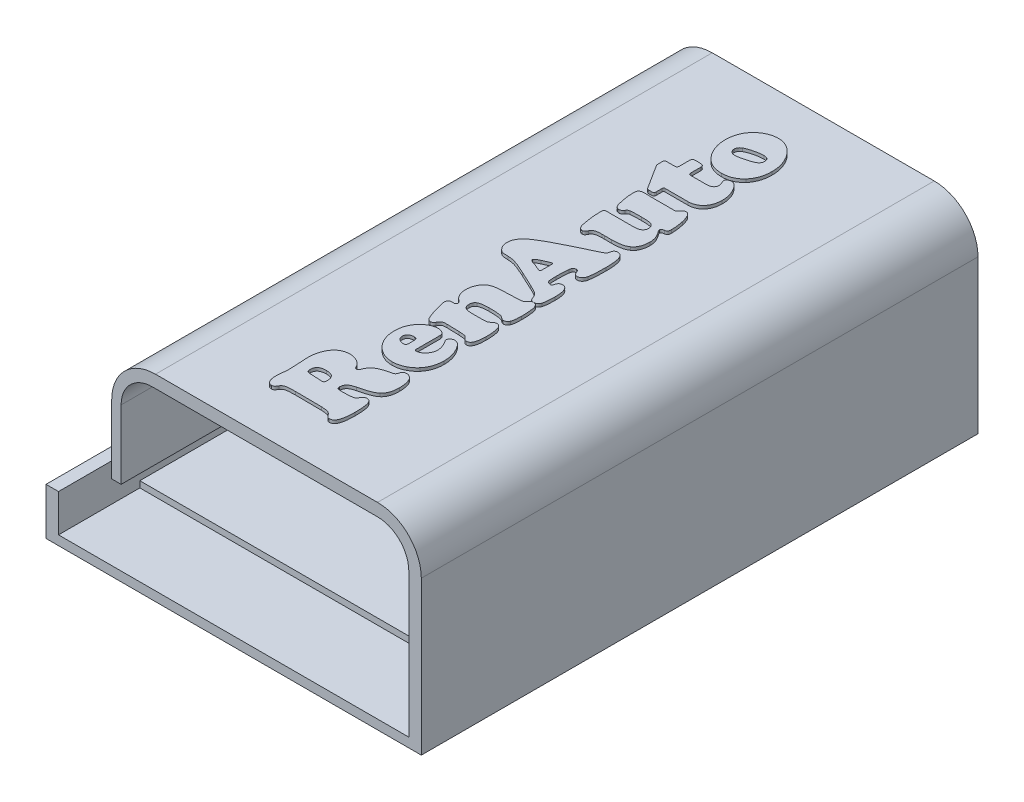
from build123d import *
from OCP.BRepFilletAPI import BRepFilletAPI_MakeFillet

# Parameters (mm, degrees)
BOSS_EXTRUDE1_DEPTH = 84
FILLET1_R1          = 7
FILLET1_R2          = 5
FILLET2_R1          = 5
FILLET2_R2          = 7
BOSS_EXTRUDE4_START = 2
BOSS_EXTRUDE4_DEPTH = 2
SKETCH8_W           = 56
SKETCH8_H           = 1
CUT_EXTRUDE1_DEPTH  = 10
BOSS_EXTRUDE7_DEPTH = 3
FILLET3_R           = 5
FILLET4_R           = 1
FILLET5_R           = 1
BOSS_EXTRUDE8_DEPTH = 0.5


with BuildPart() as part:
    # Sketch5 → Boss-Extrude1 (new body)
    with BuildSketch(Plane.XY):
        Polygon((0, 0.52755518), (56, 0.52755518), (56, 27.52755518), (10.009451629, 27.52755518), (10.009451629, 11.52755518), (8.509451629, 11.52755518), (8.509451629, 29.52755518), (58, 29.52755518), (58, -1.97244482), (-2, -1.97244482), (-2, 5.52755518), (0, 5.52755518), align=None)
    extrude(amount=-BOSS_EXTRUDE1_DEPTH)

    # Fillet1: one fillet with a radius per group of edges: ONE call of the kernel's fillet builder (fillet() takes one radius for all edges)
    fillet1_edges_1 = [part.edges().sort_by_distance(p)[0] for p in [
        (8.509451629, 29.52755518, -42),
    ]]
    fillet1_edges_2 = [part.edges().sort_by_distance(p)[0] for p in [
        (10.009451629, 27.52755518, -42),
    ]]
    fillet1 = BRepFilletAPI_MakeFillet(part.part.solid().wrapped)
    for e in fillet1_edges_1:
        fillet1.Add(FILLET1_R1, e.wrapped)
    for e in fillet1_edges_2:
        fillet1.Add(FILLET1_R2, e.wrapped)
    add(Compound.cast(fillet1.Shape()), mode=Mode.REPLACE)

    # Fillet2: one fillet with a radius per group of edges: ONE call of the kernel's fillet builder (fillet() takes one radius for all edges)
    fillet2_edges_1 = [part.edges().sort_by_distance(p)[0] for p in [
        (56, 27.52755518, -42),
    ]]
    fillet2_edges_2 = [part.edges().sort_by_distance(p)[0] for p in [
        (58, 29.52755518, -42),
    ]]
    fillet2 = BRepFilletAPI_MakeFillet(part.part.solid().wrapped)
    for e in fillet2_edges_1:
        fillet2.Add(FILLET2_R1, e.wrapped)
    for e in fillet2_edges_2:
        fillet2.Add(FILLET2_R2, e.wrapped)
    add(Compound.cast(fillet2.Shape()), mode=Mode.REPLACE)

    # Sketch6 → Boss-Extrude4 (add)
    with BuildSketch(Plane(origin=(0, 0, -84), x_dir=(-1, 0, 0), z_dir=(0, 0, -1)).offset(BOSS_EXTRUDE4_START)):
        with BuildLine():
            Line((0, 5.52755518), (2, 5.52755518))
            Line((2, 5.52755518), (2, -1.97244482))
            Line((2, -1.97244482), (-58, -1.97244482))
            Line((-58, -1.97244482), (-58, 22.52755518))
            ThreePointArc((-58, 22.52755518), (-55.949747468, 27.477302648), (-51, 29.52755518))
            Line((-51, 29.52755518), (-15.509451629, 29.52755518))
            ThreePointArc((-15.509451629, 29.52755518), (-10.559704161, 27.477302648), (-8.509451629, 22.52755518))
            Line((-8.509451629, 22.52755518), (-8.509451629, 11.52755518))
            Line((-8.509451629, 11.52755518), (-8.509451629, 5.52755518))
            Line((-8.509451629, 5.52755518), (0, 5.52755518))
        make_face()
    extrude(amount=-BOSS_EXTRUDE4_DEPTH)

    # Sketch8 → Cut-Extrude1 (cut)
    with BuildSketch(Plane.XY):
        with Locations((28, 0.02755518)):
            Rectangle(SKETCH8_W, SKETCH8_H)
    extrude(amount=-CUT_EXTRUDE1_DEPTH, mode=Mode.SUBTRACT)

    # Sketch11 → Boss-Extrude7 (add)
    with BuildSketch(Plane.XY):
        with BuildLine():
            Line((56, 22.52755518), (56, -0.47244482))
            Line((56, -0.47244482), (0, -0.47244482))
            Line((0, -0.47244482), (0, 5.52755518))
            Line((0, 5.52755518), (-2, 5.52755518))
            Line((-2, 5.52755518), (-2, -1.97244482))
            Line((-2, -1.97244482), (58, -1.97244482))
            Line((58, -1.97244482), (58, 22.52755518))
            ThreePointArc((58, 22.52755518), (55.949747468, 27.477302648), (51, 29.52755518))
            Line((51, 29.52755518), (15.509451629, 29.52755518))
            ThreePointArc((15.509451629, 29.52755518), (10.559704161, 27.477302648), (8.509451629, 22.52755518))
            Line((8.509451629, 22.52755518), (8.509451629, 11.52755518))
            Line((8.509451629, 11.52755518), (10.009451629, 11.52755518))
            Line((10.009451629, 11.52755518), (10.009451629, 22.52755518))
            ThreePointArc((10.009451629, 22.52755518), (11.473917723, 26.063089086), (15.009451629, 27.52755518))
            Line((15.009451629, 27.52755518), (51, 27.52755518))
            ThreePointArc((51, 27.52755518), (54.535533906, 26.063089086), (56, 22.52755518))
        make_face()
    extrude(amount=BOSS_EXTRUDE7_DEPTH)

    # Fillet3
    fillet3_edges = [part.edges().sort_by_distance(p)[0] for p in [
        (8.509451629, 5.52755518, -85),
    ]]
    fillet(fillet3_edges, radius=FILLET3_R)

    # Fillet4
    fillet4_edges = [part.edges().sort_by_distance(p)[0] for p in [
        (10.009451629, 17.02755518, -84),
        (11.473917723, 26.063089086, -84),
        (56, 11.52755518, -84),
        (54.535533906, 26.063089086, -84),
        (28, 0.52755518, -84),
        (33.004725815, 27.52755518, -84),
    ]]
    fillet(fillet4_edges, radius=FILLET4_R)

    # Fillet5
    fillet5_edges = [part.edges().sort_by_distance(p)[0] for p in [
        (9.759451629, 11.52755518, -84),
    ]]
    fillet(fillet5_edges, radius=FILLET5_R)

    # Sketch13 → Boss-Extrude8 (add)
    # profile 1 of 7: a face of its own
    with BuildSketch(Plane(origin=(0, 29.52755518, 0), x_dir=(1, 0, 0), z_dir=(0, 1, 0))):
        with BuildLine():
            add(Edge.make_bspline(
                [(32.469728432, 9.473421323), (32.471759623, 9.425941285), (32.47547311, 9.339136798), (32.508355868, 9.220945719), (32.56703988, 9.128510037), (32.660471527, 9.064086148), (32.796555967, 9.032408743), (32.98129612, 9.007801482), (33.227033317, 8.991897473), (33.410603218, 8.99104192), (33.512307437, 8.990567913)],
                knots=[0, 0, 0, 0, 0.856069029, 1.565092104, 2.190633063, 2.792328577, 3.560908275, 4.685462798, 6.163629124, 8, 8, 8, 8], degree=3))
            add(Edge.make_bspline(
                [(33.512307437, 8.990567913), (33.672484888, 8.992700146), (33.975416513, 8.996732679), (34.401295618, 9.01857558), (34.772156877, 9.060211508), (34.997921961, 9.104540531), (35.102600758, 9.125094236)],
                knots=[0, 0, 0, 0, 1.202242574, 2.273711406, 3.19958476, 4, 4, 4, 4], degree=3))
            add(Edge.make_bspline(
                [(35.102600758, 9.125094236), (35.151001824, 9.139249771), (35.240560889, 9.165442509), (35.337678607, 9.232353044), (35.403904099, 9.301233218), (35.451496626, 9.375413951), (35.51102392, 9.462954528), (35.546908964, 9.530649681), (35.566236122, 9.567109298)],
                knots=[0, 0, 0, 0, 1.35612568, 2.509311408, 3.137288995, 3.930265891, 4.885271557, 6, 6, 6, 6], degree=3))
            add(Edge.make_bspline(
                [(35.566236122, 9.567109298), (35.60989055, 9.642685177), (35.691701689, 9.784319117), (35.862143571, 9.945459904), (36.05554597, 10.04970389), (36.195198754, 10.06107245), (36.265292551, 10.066778499)],
                knots=[0, 0, 0, 0, 1.152105259, 2.159117568, 3.076033899, 4, 4, 4, 4], degree=3))
            add(Edge.make_bspline(
                [(36.265292551, 10.066778499), (36.307930598, 10.065215126), (36.391236814, 10.062160609), (36.511361144, 10.02979853), (36.620672519, 9.975749418), (36.721410767, 9.902490031), (36.810068622, 9.806939068), (36.890284156, 9.692299518), (36.959643268, 9.556248139), (37.018949791, 9.397953615), (37.072830931, 9.216036274), (37.113575535, 9.005728928), (37.152501559, 8.768751584), (37.183150671, 8.50259136), (37.206779842, 8.208530363), (37.222376036, 7.884844691), (37.235953941, 7.533310355), (37.235855081, 7.288985507), (37.235803883, 7.162451271)],
                knots=[0, 0, 0, 0, 0.612088259, 1.195898064, 1.772737779, 2.357795648, 2.976885584, 3.638233742, 4.364477844, 5.166480289, 6.066578473, 7.089696824, 8.244582641, 9.520167648, 10.941319601, 12.486578971, 14.18042229, 16, 16, 16, 16], degree=3))
            add(Edge.make_bspline(
                [(37.235803883, 7.162451271), (37.234625963, 7.043937122), (37.23234114, 6.814053945), (37.222090747, 6.480617722), (37.197109148, 6.170672816), (37.165773589, 5.883932274), (37.12986328, 5.619478168), (37.077627419, 5.378776606), (37.022274731, 5.159656087), (36.953634792, 4.964490539), (36.881707922, 4.789534064), (36.793707588, 4.640179027), (36.700885558, 4.511807697), (36.599227577, 4.404712822), (36.484506512, 4.325700578), (36.363495164, 4.266251961), (36.231961804, 4.23136167), (36.141382986, 4.226827622), (36.094732391, 4.224492463)],
                knots=[0, 0, 0, 0, 1.654626331, 3.209496591, 4.655899422, 5.994101378, 7.236719019, 8.378991234, 9.431054573, 10.389118449, 11.265431962, 12.066888774, 12.802490116, 13.47443329, 14.116416826, 14.736416885, 15.349219772, 16, 16, 16, 16], degree=3))
            add(Edge.make_bspline(
                [(36.094732391, 4.224492463), (36.034832344, 4.226978499), (35.924842173, 4.231543431), (35.795002662, 4.287027347), (35.707457743, 4.361511883), (35.631116206, 4.441859819), (35.543193322, 4.547826666), (35.481855131, 4.627836707), (35.448525589, 4.671312036)],
                knots=[0, 0, 0, 0, 1.300608339, 2.388214002, 2.996800135, 3.800032872, 4.804596347, 6, 6, 6, 6], degree=3))
            add(Edge.make_bspline(
                [(35.448525589, 4.671312036), (35.409328251, 4.722461531), (35.333476135, 4.821442679), (35.195422837, 4.94164753), (35.050687909, 5.040798626), (34.884477189, 5.113495835), (34.683703142, 5.166621378), (34.433332547, 5.206727689), (34.125617133, 5.243056288), (33.90077834, 5.257074154), (33.778957828, 5.264669212)],
                knots=[0, 0, 0, 0, 0.836839067, 1.619396062, 2.371074612, 3.113004861, 3.96782871, 5.068032358, 6.41142272, 8, 8, 8, 8], degree=3))
            add(Edge.make_bspline(
                [(33.778957828, 5.264669212), (33.750934272, 5.266305488), (33.686903602, 5.270044197), (33.578827411, 5.275431803), (33.447405655, 5.275855948), (33.29294981, 5.282793904), (33.115127552, 5.283669124), (32.914149862, 5.28652369), (32.689935624, 5.288782055), (32.442504117, 5.291206803), (32.171048877, 5.293630106), (31.876371401, 5.295836653), (31.558478379, 5.298992212), (31.217352216, 5.298278798), (30.852204799, 5.297550034), (30.463850147, 5.301618252), (30.052257606, 5.300453126), (29.770393436, 5.300618178), (29.625457599, 5.300703048)],
                knots=[0, 0, 0, 0, 0.324381204, 0.741174537, 1.250170341, 1.842647577, 2.527427645, 3.304729669, 4.165302823, 5.118400546, 6.164023694, 7.302172911, 8.523596023, 9.837513485, 11.243960346, 12.742965164, 14.325217883, 16, 16, 16, 16], degree=3))
            add(Edge.make_bspline(
                [(29.625457599, 5.300703048), (29.53496949, 5.300118401), (29.361188152, 5.298995592), (29.112147974, 5.293958838), (28.885426156, 5.287812092), (28.682028766, 5.275437324), (28.501035868, 5.26101144), (28.342138547, 5.24542711), (28.205956825, 5.223722601), (28.05742821, 5.193388788), (27.897123233, 5.139857614), (27.729556356, 5.045815153), (27.591465249, 4.918007274), (27.523869842, 4.814625162), (27.489852218, 4.762597755)],
                knots=[0, 0, 0, 0, 1.413580389, 2.714764326, 3.891215701, 4.956324729, 5.897502455, 6.727731684, 7.449582048, 8.050668624, 9.095007517, 10.075594235, 11.03153611, 12, 12, 12, 12], degree=3))
            add(Edge.make_bspline(
                [(27.489852218, 4.762597755), (27.462469926, 4.713359884), (27.411762213, 4.622179065), (27.331878172, 4.5007538), (27.257193885, 4.40318964), (27.156961035, 4.311505483), (27.006469639, 4.235208948), (26.875167092, 4.228217496), (26.805209323, 4.224492463)],
                knots=[0, 0, 0, 0, 1.093288183, 2.024598314, 2.82092178, 3.470311357, 4.652186279, 6, 6, 6, 6], degree=3))
            add(Edge.make_bspline(
                [(26.805209323, 4.224492463), (26.755995557, 4.227094998), (26.65878828, 4.232235538), (26.519527874, 4.278574806), (26.388490109, 4.348953231), (26.271816222, 4.451442044), (26.167894599, 4.578848674), (26.076577184, 4.727964652), (26.002057482, 4.900609839), (25.966224879, 5.024778647), (25.947604013, 5.08930454)],
                knots=[0, 0, 0, 0, 0.895619968, 1.769033021, 2.65180716, 3.594804945, 4.58074837, 5.64329719, 6.775309542, 8, 8, 8, 8], degree=3))
            add(Edge.make_bspline(
                [(25.947604013, 5.08930454), (25.933885479, 5.15240194), (25.904376209, 5.288127685), (25.87717709, 5.509844316), (25.860487032, 5.762470254), (25.859331434, 5.94127273), (25.858720549, 6.035793314)],
                knots=[0, 0, 0, 0, 0.81288152, 1.748549886, 2.809813017, 4, 4, 4, 4], degree=3))
            add(Edge.make_bspline(
                [(25.858720549, 6.035793314), (25.859455593, 6.062220044), (25.861149015, 6.123103015), (25.865839107, 6.227276062), (25.875727942, 6.355416441), (25.890405022, 6.508355535), (25.910529219, 6.685943464), (25.930795173, 6.888771503), (25.958642272, 7.115936122), (25.976577952, 7.275340703), (25.986040105, 7.359436244)],
                knots=[0, 0, 0, 0, 0.47698905, 1.098906681, 1.881213549, 2.79552976, 3.870880263, 5.105789371, 6.473129145, 8, 8, 8, 8], degree=3))
            add(Edge.make_bspline(
                [(25.986040105, 7.359436244), (25.990497683, 7.397835956), (26.000504171, 7.484036631), (26.005741471, 7.628464668), (26.010939066, 7.801411112), (26.011930921, 7.926360892), (26.012464919, 7.993631768)],
                knots=[0, 0, 0, 0, 0.730188866, 1.639147048, 2.728956187, 4, 4, 4, 4], degree=3))
            add(Edge.make_bspline(
                [(26.012464919, 7.993631768), (26.011782406, 8.124178617), (26.010316229, 8.404619644), (25.987483084, 8.855369174), (25.960846203, 9.366514707), (25.931742419, 9.727321235), (25.916374688, 9.917838641)],
                knots=[0, 0, 0, 0, 0.812825289, 1.746113066, 2.809875489, 4, 4, 4, 4], degree=3))
            add(Edge.make_bspline(
                [(25.916374688, 9.917838641), (25.908475271, 10.035554223), (25.893967446, 10.251747033), (25.872653129, 10.547029613), (25.86366784, 10.785008973), (25.860210425, 10.924381546), (25.858720549, 10.984440203)],
                knots=[0, 0, 0, 0, 1.325274581, 2.433958447, 3.325158809, 4, 4, 4, 4], degree=3))
            add(Edge.make_bspline(
                [(25.858720549, 10.984440203), (25.860458528, 11.124691826), (25.863862926, 11.399420362), (25.907215392, 11.801317461), (25.970358287, 12.184631186), (26.062021073, 12.549413129), (26.180044631, 12.895369934), (26.321071773, 13.22459641), (26.492489303, 13.533484432), (26.625814884, 13.725665221), (26.692303302, 13.821504269)],
                knots=[0, 0, 0, 0, 1.118438954, 2.190827404, 3.221135759, 4.215872456, 5.187613549, 6.134681738, 7.069780455, 8, 8, 8, 8], degree=3))
            add(Edge.make_bspline(
                [(26.692303302, 13.821504269), (26.755911612, 13.902620395), (26.880775179, 14.061851928), (27.101337577, 14.266593045), (27.336037306, 14.443698365), (27.591147713, 14.586011716), (27.863475904, 14.6981508), (28.154764542, 14.776980522), (28.464543384, 14.822440098), (28.676417305, 14.829332485), (28.784668079, 14.832853949)],
                knots=[0, 0, 0, 0, 1.022195241, 2.006576557, 2.978286514, 3.936002987, 4.898789739, 5.896093557, 6.925070626, 8, 8, 8, 8], degree=3))
            add(Edge.make_bspline(
                [(28.784668079, 14.832853949), (28.906717571, 14.829095343), (29.146352505, 14.821715605), (29.497074183, 14.751412954), (29.830089546, 14.63877641), (30.142676524, 14.481259366), (30.430768837, 14.289196176), (30.682983026, 14.058205596), (30.89912504, 13.794453883), (31.007401815, 13.595254917), (31.06200655, 13.494797484)],
                knots=[0, 0, 0, 0, 1.05161504, 2.064766495, 3.071613215, 4.075423399, 5.075329545, 6.048155205, 7.015671017, 8, 8, 8, 8], degree=3))
            add(Edge.make_bspline(
                [(31.06200655, 13.494797484), (31.082913008, 13.456134705), (31.121402244, 13.384955699), (31.195938286, 13.300956142), (31.279383937, 13.245930291), (31.339971596, 13.238819077), (31.369495289, 13.235353861)],
                knots=[0, 0, 0, 0, 1.243505163, 2.289319674, 3.166404471, 4, 4, 4, 4], degree=3))
            add(Edge.make_bspline(
                [(31.369495289, 13.235353861), (31.40843514, 13.240008948), (31.489677445, 13.249721106), (31.593721339, 13.336398881), (31.684408158, 13.461454684), (31.725954001, 13.566254894), (31.749051701, 13.624519296)],
                knots=[0, 0, 0, 0, 0.799757975, 1.668578089, 2.70382985, 4, 4, 4, 4], degree=3))
            add(Edge.make_bspline(
                [(31.749051701, 13.624519296), (31.803714111, 13.755315502), (31.9094133, 14.008232505), (32.125186545, 14.345752692), (32.380238992, 14.628144372), (32.683707274, 14.856451064), (33.040844466, 15.042533166), (33.45396006, 15.217566844), (33.932541009, 15.380353656), (34.277163804, 15.470163065), (34.458796211, 15.517496844)],
                knots=[0, 0, 0, 0, 0.979439149, 1.893914371, 2.756710762, 3.598891753, 4.506256361, 5.536410325, 6.701572477, 8, 8, 8, 8], degree=3))
            add(Edge.make_bspline(
                [(34.458796211, 15.517496844), (34.535029142, 15.529207528), (34.673252309, 15.550440974), (34.85868648, 15.594001192), (34.998868413, 15.648541368), (35.110784341, 15.711533123), (35.188534349, 15.813322939), (35.260576085, 15.946008898), (35.327878905, 16.123056592), (35.368552879, 16.256329794), (35.39087145, 16.329459295)],
                knots=[0, 0, 0, 0, 1.356053288, 2.458753433, 3.337010336, 4.000974098, 4.680423828, 5.549951791, 6.655612692, 8, 8, 8, 8], degree=3))
            add(Edge.make_bspline(
                [(35.39087145, 16.329459295), (35.41682303, 16.376712323), (35.472485428, 16.478063258), (35.624130158, 16.586336098), (35.808729052, 16.666320707), (35.947272883, 16.673916412), (36.017860207, 16.677786382)],
                knots=[0, 0, 0, 0, 0.846256424, 1.815098053, 2.886804424, 4, 4, 4, 4], degree=3))
            add(Edge.make_bspline(
                [(36.017860207, 16.677786382), (36.065311438, 16.675382446), (36.161548559, 16.670506961), (36.305531589, 16.632672991), (36.448043109, 16.568673521), (36.587298559, 16.482322721), (36.722085079, 16.379751572), (36.843768943, 16.260883905), (36.949735273, 16.125484533), (37.007132968, 16.026717548), (37.036416654, 15.976327696)],
                knots=[0, 0, 0, 0, 0.880079593, 1.784913158, 2.74322313, 3.770514443, 4.819932606, 5.881490433, 6.91915923, 8, 8, 8, 8], degree=3))
            add(Edge.make_bspline(
                [(37.036416654, 15.976327696), (37.064563994, 15.91666129), (37.122236273, 15.794408259), (37.19335064, 15.598084941), (37.257186402, 15.386932463), (37.302949695, 15.158122396), (37.34178741, 14.914536209), (37.370463238, 14.655652927), (37.38751384, 14.38066314), (37.388857167, 14.192277748), (37.389548252, 14.095361427)],
                knots=[0, 0, 0, 0, 0.819654588, 1.679425052, 2.592780972, 3.559109233, 4.576968081, 5.658581767, 6.7954393, 8, 8, 8, 8], degree=3))
            add(Edge.make_bspline(
                [(37.389548252, 14.095361427), (37.38759912, 13.967138092), (37.383837421, 13.719675293), (37.345125304, 13.362817682), (37.281063093, 13.033697275), (37.19047328, 12.733307261), (37.074943737, 12.46009416), (36.931861932, 12.215872264), (36.765377552, 11.99581552), (36.630122958, 11.87528367), (36.563172267, 11.8156207)],
                knots=[0, 0, 0, 0, 1.228014555, 2.369989183, 3.433653895, 4.43590286, 5.370674562, 6.267992542, 7.142660573, 8, 8, 8, 8], degree=3))
            add(Edge.make_bspline(
                [(36.563172267, 11.8156207), (36.49847171, 11.764608754), (36.365655695, 11.659892445), (36.141725918, 11.524798315), (35.897337887, 11.396209845), (35.67232236, 11.303570552), (35.474669214, 11.232021722), (35.30513718, 11.173546636), (35.115870028, 11.114265639), (34.906855368, 11.051799563), (34.67856599, 10.987133939), (34.430403865, 10.919540753), (34.162736758, 10.850652903), (33.977568693, 10.804173424), (33.882254826, 10.780248463)],
                knots=[0, 0, 0, 0, 1.022821445, 2.099627513, 3.243306495, 4.451797978, 5.119085722, 5.855352394, 6.679785309, 7.583224139, 8.565864952, 9.627859951, 10.778958775, 12, 12, 12, 12], degree=3))
            add(Edge.make_bspline(
                [(33.882254826, 10.780248463), (33.763865218, 10.748804451), (33.543509499, 10.690278472), (33.245058836, 10.576575876), (32.999263864, 10.454995684), (32.804924645, 10.313354807), (32.661586106, 10.143527161), (32.556855957, 9.948364936), (32.491678437, 9.720629777), (32.477303138, 9.558730251), (32.469728432, 9.473421323)],
                knots=[0, 0, 0, 0, 1.39615236, 2.598624671, 3.636044608, 4.516390929, 5.31971346, 6.149136772, 7.024733672, 8, 8, 8, 8], degree=3))
        make_face()
        with BuildLine():
            Line((28.328239482, 8.928109263), (30.098701986, 8.836823544))
            add(Edge.make_bspline(
                [(30.098701986, 8.836823544), (30.108311009, 8.836823544), (30.131532815, 8.836823544), (30.154754621, 8.836823544), (30.168367403, 8.836823544)],
                knots=[0, 0, 0, 0, 0.827586207, 2, 2, 2, 2], degree=3))
            add(Edge.make_bspline(
                [(30.168367403, 8.836823544), (30.210087629, 8.837311197), (30.28673559, 8.83820711), (30.390151054, 8.854811263), (30.472808613, 8.879588304), (30.53649018, 8.919856577), (30.580279871, 8.981624802), (30.606725771, 9.062387509), (30.623524109, 9.163637485), (30.624344162, 9.237913536), (30.624796, 9.278838606)],
                knots=[0, 0, 0, 0, 1.319177282, 2.423578654, 3.305381546, 4.036588809, 4.761617988, 5.6517622, 6.706153673, 8, 8, 8, 8], degree=3))
            add(Edge.make_bspline(
                [(30.624796, 9.278838606), (30.621366721, 9.393717077), (30.614970254, 9.60799434), (30.550187819, 9.90544958), (30.443365259, 10.155031104), (30.286350524, 10.35696409), (30.077792382, 10.507691342), (29.819624668, 10.609741701), (29.51220178, 10.671168708), (29.29026249, 10.678064054), (29.171431258, 10.681755976)],
                knots=[0, 0, 0, 0, 1.179125753, 2.199366309, 3.10929602, 3.947276857, 4.794940081, 5.721062179, 6.779806001, 8, 8, 8, 8], degree=3))
            add(Edge.make_bspline(
                [(29.171431258, 10.681755976), (29.056636033, 10.679488937), (28.840721306, 10.675224933), (28.539858783, 10.619122656), (28.282103852, 10.532709123), (28.068957524, 10.406449275), (27.9021435, 10.2409214), (27.784321131, 10.038100577), (27.716361618, 9.798734887), (27.70805147, 9.628425485), (27.703652982, 9.538282229)],
                knots=[0, 0, 0, 0, 1.296654376, 2.438836404, 3.447100336, 4.357284285, 5.215424562, 6.075951086, 6.981617965, 8, 8, 8, 8], degree=3))
            add(Edge.make_bspline(
                [(27.703652982, 9.538282229), (27.705717944, 9.487772843), (27.709547194, 9.394108589), (27.731316926, 9.264040671), (27.774700904, 9.158090176), (27.836532994, 9.072495359), (27.925947538, 9.013597207), (28.036207536, 8.967125721), (28.174356542, 8.941489138), (28.274522319, 8.932779884), (28.328239482, 8.928109263)],
                knots=[0, 0, 0, 0, 1.199115662, 2.223631729, 3.10910769, 3.895523655, 4.686058208, 5.613917523, 6.720385483, 8, 8, 8, 8], degree=3))
        make_face(mode=Mode.SUBTRACT)
    # profile 2 of 7: a face of its own
    with BuildSketch(Plane(origin=(0, 29.52755518, 0), x_dir=(1, 0, 0), z_dir=(0, 1, 0))):
        with BuildLine():
            Line((33.392194649, 24.64366652), (33.392194649, 20.776034728))
            add(Edge.make_bspline(
                [(33.392194649, 20.776034728), (33.393884943, 20.738536048), (33.396962714, 20.670256644), (33.445888717, 20.581646378), (33.530435024, 20.528223416), (33.596358015, 20.523809942), (33.632420226, 20.521395616)],
                knots=[0, 0, 0, 0, 1.118405153, 2.036446046, 2.925866451, 4, 4, 4, 4], degree=3))
            add(Edge.make_bspline(
                [(33.632420226, 20.521395616), (33.680576033, 20.523442717), (33.776794336, 20.527532954), (33.91988969, 20.554577296), (34.060364699, 20.600646683), (34.197516686, 20.66663751), (34.33343704, 20.749521593), (34.468030557, 20.849743824), (34.597215857, 20.972361337), (34.767293265, 21.150657346), (34.953357917, 21.392921147), (35.11695719, 21.706348421), (35.21986328, 22.032430288), (35.231376268, 22.255102051), (35.237127081, 22.366328048)],
                knots=[0, 0, 0, 0, 0.649890685, 1.298522065, 1.958135115, 2.639780487, 3.347817495, 4.104343987, 4.89970707, 5.748286777, 7.429959321, 9.000958108, 10.501959025, 12, 12, 12, 12], degree=3))
            add(Edge.make_bspline(
                [(35.237127081, 22.366328048), (35.235348805, 22.434509949), (35.231670211, 22.575553051), (35.197680674, 22.791427142), (35.147815349, 23.018968293), (35.075009911, 23.250481134), (34.995341244, 23.480088412), (34.897718441, 23.690759906), (34.79642438, 23.883045745), (34.716212016, 23.997387607), (34.677401486, 24.0527116)],
                knots=[0, 0, 0, 0, 0.907868676, 1.878044067, 2.905652209, 4.00931383, 5.109514959, 6.140827202, 7.100444392, 8, 8, 8, 8], degree=3))
            add(Edge.make_bspline(
                [(34.677401486, 24.0527116), (34.645807389, 24.096880145), (34.587685126, 24.178135064), (34.524205096, 24.298946075), (34.476084169, 24.403117333), (34.470800108, 24.471115079), (34.468405234, 24.501933429)],
                knots=[0, 0, 0, 0, 1.294819544, 2.382022262, 3.266690342, 4, 4, 4, 4], degree=3))
            add(Edge.make_bspline(
                [(34.468405234, 24.501933429), (34.470901479, 24.53854696), (34.476055292, 24.614140241), (34.530852762, 24.721895542), (34.60826345, 24.829253564), (34.715684789, 24.927655071), (34.835429291, 25.018608267), (34.965856767, 25.081649773), (35.096259525, 25.128292638), (35.18548282, 25.131920064), (35.229920314, 25.133726697)],
                knots=[0, 0, 0, 0, 0.814239558, 1.681100871, 2.656896924, 3.773227989, 4.928362544, 6.011196755, 7.009480291, 8, 8, 8, 8], degree=3))
            add(Edge.make_bspline(
                [(35.229920314, 25.133726697), (35.276538049, 25.131142609), (35.370935151, 25.125910044), (35.511592387, 25.091306839), (35.649260375, 25.032206134), (35.785689808, 24.951464225), (35.920506054, 24.846727711), (36.054195175, 24.719046546), (36.186884116, 24.569628218), (36.268584373, 24.458595051), (36.310935411, 24.401038687)],
                knots=[0, 0, 0, 0, 0.82498976, 1.670536798, 2.546989518, 3.468130553, 4.468695663, 5.561364867, 6.735882474, 8, 8, 8, 8], degree=3))
            add(Edge.make_bspline(
                [(36.310935411, 24.401038687), (36.385005298, 24.292573421), (36.532680488, 24.076323207), (36.718021383, 23.730475504), (36.880472991, 23.375945038), (37.01115343, 23.006904311), (37.111182164, 22.625833088), (37.183280655, 22.232385644), (37.227850379, 21.826851207), (37.233126356, 21.55207818), (37.235803883, 21.412632507)],
                knots=[0, 0, 0, 0, 0.990566295, 1.974919532, 2.956672389, 3.931463233, 4.925268486, 5.926833671, 6.947880448, 8, 8, 8, 8], degree=3))
            add(Edge.make_bspline(
                [(37.235803883, 21.412632507), (37.233298271, 21.273177475), (37.228373771, 20.999094217), (37.181757431, 20.596440113), (37.104558095, 20.21103328), (37.00000462, 19.842145068), (36.861505366, 19.490975733), (36.693240832, 19.157515674), (36.496398919, 18.839150459), (36.341003279, 18.644557658), (36.262890295, 18.546741372)],
                knots=[0, 0, 0, 0, 1.082447791, 2.12742998, 3.14189322, 4.131689484, 5.100347186, 6.067946824, 7.028811626, 8, 8, 8, 8], degree=3))
            add(Edge.make_bspline(
                [(36.262890295, 18.546741372), (36.181581089, 18.455078085), (36.018847895, 18.271622113), (35.737879874, 18.030932754), (35.438889776, 17.805848064), (35.220219515, 17.682003041), (35.109807525, 17.619470644)],
                knots=[0, 0, 0, 0, 0.987025202, 1.975443763, 2.977751789, 4, 4, 4, 4], degree=3))
            add(Edge.make_bspline(
                [(35.109807525, 17.619470644), (34.959242654, 17.54603023), (34.661028733, 17.400571642), (34.189324135, 17.250131717), (33.705716795, 17.157703077), (33.37899224, 17.145277833), (33.214427722, 17.13901949)],
                knots=[0, 0, 0, 0, 1.017240999, 2.014782227, 3.000086156, 4, 4, 4, 4], degree=3))
            add(Edge.make_bspline(
                [(33.214427722, 17.13901949), (33.10455947, 17.140760038), (32.886439567, 17.144215525), (32.564197763, 17.18925875), (32.248062542, 17.248222512), (31.942877147, 17.342139956), (31.64420691, 17.456307298), (31.357544498, 17.60348155), (31.072968153, 17.766627645), (30.896585841, 17.898627024), (30.807367439, 17.965395475)],
                knots=[0, 0, 0, 0, 1.016106697, 2.017262424, 3.007160793, 3.989706262, 4.968330048, 5.962741129, 6.969505616, 8, 8, 8, 8], degree=3))
            add(Edge.make_bspline(
                [(30.807367439, 17.965395475), (30.731991121, 18.026011828), (30.581978927, 18.146649084), (30.374278527, 18.345058316), (30.177012562, 18.550942077), (30.000510007, 18.774349991), (29.83321983, 19.005899581), (29.6855162, 19.253347224), (29.546337733, 19.509074884), (29.469511462, 19.688742315), (29.430874882, 19.779098582)],
                knots=[0, 0, 0, 0, 1.0074289, 2.004961572, 2.99069951, 3.975836937, 4.969068146, 5.965029268, 6.976596036, 8, 8, 8, 8], degree=3))
            add(Edge.make_bspline(
                [(29.430874882, 19.779098582), (29.377090483, 19.91897728), (29.269433258, 20.198964647), (29.167242726, 20.641711732), (29.099028629, 21.09899511), (29.091279574, 21.410769827), (29.087352306, 21.568779132)],
                knots=[0, 0, 0, 0, 0.979627735, 1.960866068, 2.966554636, 4, 4, 4, 4], degree=3))
            add(Edge.make_bspline(
                [(29.087352306, 21.568779132), (29.090482357, 21.69457829), (29.096637484, 21.941957568), (29.134526291, 22.306973454), (29.202698014, 22.656742997), (29.292806728, 22.993495996), (29.413837909, 23.314002295), (29.561591928, 23.619283902), (29.730829347, 23.913520254), (29.866929268, 24.09407053), (29.935348594, 24.184835667)],
                knots=[0, 0, 0, 0, 1.077219717, 2.118311762, 3.137569144, 4.125561753, 5.09975504, 6.065734704, 7.02761791, 8, 8, 8, 8], degree=3))
            add(Edge.make_bspline(
                [(29.935348594, 24.184835667), (30.008094632, 24.272897847), (30.151595127, 24.446611314), (30.396024719, 24.678541799), (30.656952256, 24.88731928), (30.84688291, 25.003527206), (30.941893762, 25.061659024)],
                knots=[0, 0, 0, 0, 1.019916929, 2.011911422, 3.005479179, 4, 4, 4, 4], degree=3))
            add(Edge.make_bspline(
                [(30.941893762, 25.061659024), (31.049564795, 25.119532245), (31.258876916, 25.232037588), (31.584665353, 25.352836115), (31.908328791, 25.426224687), (32.123445414, 25.436265221), (32.229502855, 25.441215436)],
                knots=[0, 0, 0, 0, 1.079725634, 2.098982945, 3.06275488, 4, 4, 4, 4], degree=3))
            add(Edge.make_bspline(
                [(32.229502855, 25.441215436), (32.311365461, 25.438495349), (32.468185339, 25.433284622), (32.691734121, 25.392613655), (32.892415702, 25.323738156), (33.064011388, 25.223748876), (33.212169446, 25.109981709), (33.31444724, 24.968124161), (33.383338506, 24.812160208), (33.389210104, 24.70044935), (33.392194649, 24.64366652)],
                knots=[0, 0, 0, 0, 1.252842741, 2.400004802, 3.466480044, 4.482416587, 5.432273362, 6.300424151, 7.136102538, 8, 8, 8, 8], degree=3))
        make_face()
        with BuildLine():
            Line((32.008495324, 21.042685118), (32.008495324, 21.852245313))
            add(Edge.make_bspline(
                [(32.008495324, 21.852245313), (32.007452859, 21.89240571), (32.005471318, 21.968743441), (31.981832029, 22.074785249), (31.942014224, 22.165442299), (31.887528902, 22.242043836), (31.811542374, 22.297685638), (31.72373367, 22.339359235), (31.619775081, 22.363486751), (31.545789355, 22.365341301), (31.506423868, 22.366328048)],
                knots=[0, 0, 0, 0, 1.167978623, 2.220118426, 3.138726847, 4.038799772, 4.920255853, 5.848579037, 6.855296304, 8, 8, 8, 8], degree=3))
            add(Edge.make_bspline(
                [(31.506423868, 22.366328048), (31.433196905, 22.364343636), (31.292198049, 22.36052264), (31.092282263, 22.309178851), (30.910508813, 22.234605212), (30.757749678, 22.122003491), (30.629532616, 21.989516102), (30.53663185, 21.833639522), (30.481959303, 21.656373932), (30.474781364, 21.532335875), (30.471051631, 21.46788439)],
                knots=[0, 0, 0, 0, 1.140164242, 2.195391548, 3.20334562, 4.188716649, 5.135004962, 6.065553322, 6.99484106, 8, 8, 8, 8], degree=3))
            add(Edge.make_bspline(
                [(30.471051631, 21.46788439), (30.475584456, 21.39681716), (30.484424313, 21.258222758), (30.556437397, 21.062559301), (30.679080296, 20.892749529), (30.788920691, 20.806359721), (30.845803531, 20.761621193)],
                knots=[0, 0, 0, 0, 1.02222219, 1.993524615, 2.960910344, 4, 4, 4, 4], degree=3))
            add(Edge.make_bspline(
                [(30.845803531, 20.761621193), (30.903254324, 20.72451162), (31.01416199, 20.652872294), (31.192285474, 20.578988714), (31.369964034, 20.529090741), (31.49008246, 20.523947034), (31.549664472, 20.521395616)],
                knots=[0, 0, 0, 0, 1.085037564, 2.094644411, 3.054891718, 4, 4, 4, 4], degree=3))
            add(Edge.make_bspline(
                [(31.549664472, 20.521395616), (31.58901975, 20.522538208), (31.662025985, 20.524657779), (31.762382632, 20.545801754), (31.844711648, 20.581294908), (31.909437558, 20.63513609), (31.956404302, 20.708781741), (31.985575798, 20.802267973), (32.004970183, 20.915374545), (32.007250819, 20.99773978), (32.008495324, 21.042685118)],
                knots=[0, 0, 0, 0, 1.163416599, 2.158202649, 3.017264467, 3.791022796, 4.612657866, 5.56445396, 6.670963038, 8, 8, 8, 8], degree=3))
        make_face(mode=Mode.SUBTRACT)
    # profile 3 of 7: a face of its own
    with BuildSketch(Plane(origin=(0, 29.52755518, 0), x_dir=(1, 0, 0), z_dir=(0, 1, 0))):
        with BuildLine():
            Line((32.015702092, 35.780524276), (34.855168413, 35.895832553))
            add(Edge.make_bspline(
                [(34.855168413, 35.895832553), (34.905761685, 35.898604927), (35.000319685, 35.903786449), (35.130240349, 35.929044046), (35.239973436, 35.958293863), (35.338570196, 36.003932313), (35.439879067, 36.082570741), (35.571970797, 36.191340437), (35.733028056, 36.351308517), (35.854394643, 36.469319874), (35.921769976, 36.534832588)],
                knots=[0, 0, 0, 0, 0.943366149, 1.763135971, 2.462324943, 3.056604638, 3.773262258, 4.843548789, 6.24773064, 8, 8, 8, 8], degree=3))
            add(Edge.make_bspline(
                [(35.921769976, 36.534832588), (35.944101618, 36.555319061), (35.9895166, 36.596981597), (36.077100889, 36.637198014), (36.17665351, 36.661479922), (36.24751607, 36.663499867), (36.284510597, 36.6645544)],
                knots=[0, 0, 0, 0, 0.913373708, 1.857492231, 2.881481818, 4, 4, 4, 4], degree=3))
            add(Edge.make_bspline(
                [(36.284510597, 36.6645544), (36.32710185, 36.662771955), (36.410118572, 36.659297704), (36.530375654, 36.630206227), (36.639733958, 36.578384873), (36.739614945, 36.508319085), (36.826958643, 36.416890263), (36.904035838, 36.307362372), (36.971757277, 36.178169198), (37.028659254, 36.026962274), (37.079664715, 35.851182192), (37.121756802, 35.64627071), (37.157383247, 35.410498426), (37.184852973, 35.143447023), (37.209408671, 34.845565891), (37.225380862, 34.517086895), (37.235157875, 34.157461915), (37.235582224, 33.907572748), (37.235803883, 33.777042962)],
                knots=[0, 0, 0, 0, 0.614879457, 1.198492046, 1.772975194, 2.353944648, 2.951157802, 3.589949804, 4.283390565, 5.052506647, 5.920151552, 6.925289039, 8.072215111, 9.363811729, 10.80297517, 12.389940686, 14.114282919, 16, 16, 16, 16], degree=3))
            add(Edge.make_bspline(
                [(37.235803883, 33.777042962), (37.235643868, 33.688145513), (37.235336705, 33.517499043), (37.224679795, 33.271642854), (37.211651715, 33.046373801), (37.189904279, 32.840385546), (37.161853233, 32.655160739), (37.127670399, 32.490164292), (37.09129777, 32.344716431), (37.05726293, 32.256945909), (37.041221165, 32.215576711)],
                knots=[0, 0, 0, 0, 1.348466818, 2.588500613, 3.732722968, 4.771062755, 5.72974341, 6.573123183, 7.327464984, 8, 8, 8, 8], degree=3))
            add(Edge.make_bspline(
                [(37.041221165, 32.215576711), (37.005891865, 32.144093275), (36.939517473, 32.009794843), (36.782787246, 31.854784899), (36.591830828, 31.759091138), (36.452162044, 31.749598343), (36.380600828, 31.74473458)],
                knots=[0, 0, 0, 0, 1.101920216, 2.070216049, 3.011248745, 4, 4, 4, 4], degree=3))
            add(Edge.make_bspline(
                [(36.380600828, 31.74473458), (36.334048244, 31.746803683), (36.252337678, 31.750435438), (36.151038621, 31.777438405), (36.077014474, 31.82824159), (35.998436318, 31.889322995), (35.890110367, 31.973229667), (35.808782715, 32.037716574), (35.763221095, 32.07384362)],
                knots=[0, 0, 0, 0, 1.167066802, 2.048472509, 2.571246999, 3.401222628, 4.544105204, 6, 6, 6, 6], degree=3))
            add(Edge.make_bspline(
                [(35.763221095, 32.07384362), (35.727175791, 32.097836331), (35.644123629, 32.153118054), (35.478778768, 32.20542512), (35.268944344, 32.256016576), (35.007122644, 32.291230366), (34.697913997, 32.321877264), (34.338229028, 32.346582968), (33.928754705, 32.356335709), (33.638828056, 32.358546039), (33.485882624, 32.359712057)],
                knots=[0, 0, 0, 0, 0.446530282, 1.028852621, 1.779025327, 2.684320166, 3.759387767, 4.997654159, 6.416168076, 8, 8, 8, 8], degree=3))
            add(Edge.make_bspline(
                [(33.485882624, 32.359712057), (33.395387901, 32.358611322), (33.219923244, 32.356477052), (32.965817961, 32.345199882), (32.730117536, 32.323813286), (32.513417339, 32.29338939), (32.315628947, 32.251735419), (32.135210934, 32.205231941), (31.97298716, 32.147594252), (31.873645783, 32.101021084), (31.825923886, 32.078648132)],
                knots=[0, 0, 0, 0, 1.279185315, 2.480275141, 3.594151077, 4.623383609, 5.571232112, 6.449780193, 7.255300946, 8, 8, 8, 8], degree=3))
            add(Edge.make_bspline(
                [(31.825923886, 32.078648132), (31.791511054, 32.058953328), (31.723018438, 32.019754326), (31.635199596, 31.941787755), (31.558659706, 31.854566548), (31.498003917, 31.753381238), (31.450474717, 31.640986139), (31.416273111, 31.515836175), (31.398108047, 31.379328174), (31.395077842, 31.284351675), (31.393517847, 31.235456356)],
                knots=[0, 0, 0, 0, 0.948924403, 1.888665135, 2.801311401, 3.723811356, 4.705047962, 5.72102276, 6.826748501, 8, 8, 8, 8], degree=3))
            add(Edge.make_bspline(
                [(31.393517847, 31.235456356), (31.397095232, 31.144613382), (31.40375905, 30.975394557), (31.466542887, 30.741614128), (31.581563122, 30.556311214), (31.71188676, 30.436898441), (31.842045434, 30.371912694), (31.956409583, 30.325637926), (32.090158743, 30.291757744), (32.23973517, 30.259533755), (32.40758169, 30.236364206), (32.592837615, 30.220756567), (32.795440706, 30.20706282), (32.936539807, 30.207212637), (33.010235981, 30.207290886)],
                knots=[0, 0, 0, 0, 1.472303549, 2.742550854, 3.874231517, 4.96901399, 5.555783174, 6.226276412, 6.966712326, 7.789485977, 8.707883697, 9.712091868, 10.805023743, 12, 12, 12, 12], degree=3))
            Line((33.010235981, 30.207290886), (34.619747348, 30.207290886))
            add(Edge.make_bspline(
                [(34.619747348, 30.207290886), (34.693417612, 30.20834151), (34.828063077, 30.210261713), (35.011265572, 30.220386539), (35.156607698, 30.241629669), (35.280531802, 30.271317733), (35.403928034, 30.335228046), (35.555622262, 30.429203085), (35.748175384, 30.563599676), (35.889175906, 30.666615506), (35.967412836, 30.723775877)],
                knots=[0, 0, 0, 0, 1.188401549, 2.172014452, 2.955544567, 3.556998765, 4.215504343, 5.1833921, 6.437149369, 8, 8, 8, 8], degree=3))
            add(Edge.make_bspline(
                [(35.967412836, 30.723775877), (36.018210566, 30.752796922), (36.121681465, 30.81191046), (36.240725512, 30.81877426), (36.301326388, 30.822268364)],
                knots=[0, 0, 0, 0, 0.981874739, 2, 2, 2, 2], degree=3))
            add(Edge.make_bspline(
                [(36.301326388, 30.822268364), (36.340007897, 30.820723769), (36.41630585, 30.817677109), (36.526034171, 30.784200677), (36.629183008, 30.733371948), (36.723827576, 30.659913287), (36.808050253, 30.564736131), (36.881793504, 30.449156562), (36.952844605, 30.31688824), (37.011605282, 30.161363897), (37.063442709, 29.985151214), (37.112719263, 29.787644576), (37.149690403, 29.56581898), (37.17967254, 29.321227833), (37.207783531, 29.053899882), (37.221889938, 28.763629299), (37.236073133, 28.450575452), (37.235895801, 28.234258621), (37.235803883, 28.122132876)],
                knots=[0, 0, 0, 0, 0.597200446, 1.177957432, 1.760168461, 2.370229831, 3.019950073, 3.718030984, 4.488946978, 5.340855831, 6.286170272, 7.33266751, 8.490469719, 9.765367153, 11.148364126, 12.651115138, 14.264137803, 16, 16, 16, 16], degree=3))
            add(Edge.make_bspline(
                [(37.235803883, 28.122132876), (37.234429616, 28.032450823), (37.231766244, 27.858644269), (37.224200396, 27.606880085), (37.203060564, 27.373195653), (37.181274338, 27.156366236), (37.146978185, 26.956876672), (37.106634305, 26.773923153), (37.059415584, 26.608271517), (37.00400553, 26.4604263), (36.941888448, 26.329780212), (36.872082148, 26.216063491), (36.796007257, 26.118487158), (36.709560683, 26.040741086), (36.618759182, 25.976685589), (36.517651094, 25.932142445), (36.408848664, 25.909182126), (36.334249995, 25.904710207), (36.296521876, 25.902448544)],
                knots=[0, 0, 0, 0, 1.626457141, 3.152123511, 4.565308896, 5.880116765, 7.10226897, 8.23302984, 9.276121079, 10.222684753, 11.092893677, 11.894766118, 12.638533766, 13.327106936, 13.995640627, 14.645789116, 15.315110708, 16, 16, 16, 16], degree=3))
            add(Edge.make_bspline(
                [(36.296521876, 25.902448544), (36.238556311, 25.904783174), (36.134909664, 25.908957663), (36.011033985, 25.952700924), (35.933231097, 26.020449529), (35.868163265, 26.093225222), (35.787922862, 26.186476709), (35.734646915, 26.259151946), (35.705566956, 26.298820746)],
                knots=[0, 0, 0, 0, 1.388002239, 2.481848987, 3.054262402, 3.841645056, 4.821890998, 6, 6, 6, 6], degree=3))
            add(Edge.make_bspline(
                [(35.705566956, 26.298820746), (35.680132714, 26.33171944), (35.631073712, 26.395176298), (35.54426209, 26.472813054), (35.45018216, 26.52963799), (35.340110318, 26.572431985), (35.189924426, 26.599703387), (34.979708824, 26.624270457), (34.696943497, 26.650699616), (34.483666032, 26.663856611), (34.365108236, 26.671170391)],
                knots=[0, 0, 0, 0, 0.689978248, 1.33086898, 1.921890835, 2.507495879, 3.282549819, 4.449367948, 6.026256028, 8, 8, 8, 8], degree=3))
            add(Edge.make_bspline(
                [(34.365108236, 26.671170391), (34.047272759, 26.686987339), (33.395861078, 26.719404567), (32.743655026, 26.724045656), (32.409672038, 26.726422273)],
                knots=[0, 0, 0, 0, 0.975835976, 2, 2, 2, 2], degree=3))
            add(Edge.make_bspline(
                [(32.409672038, 26.726422273), (32.323989969, 26.725840942), (32.168428236, 26.724785494), (31.958392447, 26.709737849), (31.796894268, 26.681954001), (31.668679011, 26.645139483), (31.566456364, 26.566787868), (31.46427167, 26.457249479), (31.354899854, 26.302573219), (31.282220425, 26.183988831), (31.242175733, 26.118651563)],
                knots=[0, 0, 0, 0, 1.439883419, 2.614208088, 3.530004315, 4.198003853, 4.825191597, 5.662619656, 6.712157231, 8, 8, 8, 8], degree=3))
            add(Edge.make_bspline(
                [(31.242175733, 26.118651563), (31.205111703, 26.063244051), (31.136118996, 25.960105935), (31.005574687, 25.839121189), (30.858649506, 25.763055567), (30.753736629, 25.753464325), (30.701668185, 25.748704174)],
                knots=[0, 0, 0, 0, 1.164875323, 2.168353035, 3.090950412, 4, 4, 4, 4], degree=3))
            add(Edge.make_bspline(
                [(30.701668185, 25.748704174), (30.652276561, 25.751517676), (30.555233685, 25.757045543), (30.418785616, 25.813985985), (30.297366203, 25.904048614), (30.210341437, 26.007358554), (30.144918629, 26.111062684), (30.09361943, 26.21018909), (30.034199244, 26.325931545), (29.976567188, 26.461676049), (29.91274233, 26.615195002), (29.846433283, 26.786664812), (29.776247942, 26.977094557), (29.730848392, 27.110674292), (29.707134295, 27.180448614)],
                knots=[0, 0, 0, 0, 0.954485759, 1.875339086, 2.820538629, 3.867626593, 4.475683874, 5.198999301, 6.033247008, 7.000808523, 8.060285777, 9.261203308, 10.569411123, 12, 12, 12, 12], degree=3))
            add(Edge.make_bspline(
                [(29.707134295, 27.180448614), (29.624813313, 27.431204332), (29.464253448, 27.920281393), (29.299740183, 28.526054515), (29.190606436, 28.968894148), (29.135457403, 29.241432225), (29.097900812, 29.457612846), (29.090495795, 29.584213353), (29.087352306, 29.637956268)],
                knots=[0, 0, 0, 0, 1.870183004, 3.647628121, 4.447360987, 5.10180177, 5.618707758, 6, 6, 6, 6], degree=3))
            add(Edge.make_bspline(
                [(29.087352306, 29.637956268), (29.089956355, 29.676578893), (29.095036062, 29.751919861), (29.126415708, 29.86101484), (29.183731547, 29.95871066), (29.260678812, 30.043978284), (29.351332666, 30.116251035), (29.45236185, 30.169121871), (29.561684056, 30.202871909), (29.637219292, 30.205794215), (29.67590497, 30.207290886)],
                knots=[0, 0, 0, 0, 1.020500109, 1.990684675, 2.966384308, 3.984910739, 5.008691856, 6.011289003, 6.981473569, 8, 8, 8, 8], degree=3))
            add(Edge.make_bspline(
                [(29.67590497, 30.207290886), (29.683114285, 30.207374116), (29.703964732, 30.20761483), (29.743933805, 30.204061753), (29.803217539, 30.202269397), (29.848867702, 30.2008853), (29.875292199, 30.200084119)],
                knots=[0, 0, 0, 0, 0.433393662, 1.253441231, 2.410160454, 4, 4, 4, 4], degree=3))
            add(Edge.make_bspline(
                [(29.875292199, 30.200084119), (29.895299784, 30.198306835), (29.932079199, 30.1950397), (29.968972295, 30.193554582), (29.985795965, 30.192877351)],
                knots=[0, 0, 0, 0, 1.087977302, 2, 2, 2, 2], degree=3))
            add(Edge.make_bspline(
                [(29.985795965, 30.192877351), (30.042528064, 30.196062919), (30.143478768, 30.201731409), (30.27742671, 30.263911483), (30.358022635, 30.380889603), (30.364354165, 30.472685616), (30.367754632, 30.521986392)],
                knots=[0, 0, 0, 0, 1.181964001, 2.103220236, 2.981298746, 4, 4, 4, 4], degree=3))
            add(Edge.make_bspline(
                [(30.367754632, 30.521986392), (30.363433175, 30.556251588), (30.354182839, 30.62959827), (30.291926663, 30.735760857), (30.195005618, 30.842113363), (30.112696749, 30.906825485), (30.067472661, 30.942381152)],
                knots=[0, 0, 0, 0, 0.770303879, 1.64888105, 2.708192531, 4, 4, 4, 4], degree=3))
            add(Edge.make_bspline(
                [(30.067472661, 30.942381152), (29.988620375, 31.002631021), (29.833554877, 31.121114281), (29.637057207, 31.335486732), (29.463558059, 31.562341941), (29.326580234, 31.814310253), (29.216593433, 32.083727136), (29.144955673, 32.376111535), (29.09350261, 32.686207809), (29.089435783, 32.900790496), (29.087352306, 33.010723371)],
                knots=[0, 0, 0, 0, 0.997645434, 1.961901103, 2.91846902, 3.867938004, 4.841459119, 5.841091345, 6.893969323, 8, 8, 8, 8], degree=3))
            add(Edge.make_bspline(
                [(29.087352306, 33.010723371), (29.088249052, 33.095691542), (29.090021768, 33.26365939), (29.1186601, 33.50979472), (29.157646186, 33.748102105), (29.219255412, 33.975475823), (29.292636802, 34.195442743), (29.385447867, 34.405367963), (29.491593726, 34.607694251), (29.577741628, 34.733122077), (29.620653088, 34.795599409)],
                knots=[0, 0, 0, 0, 1.076203516, 2.127474161, 3.136909911, 4.133871287, 5.109529397, 6.073024168, 7.040146729, 8, 8, 8, 8], degree=3))
            add(Edge.make_bspline(
                [(29.620653088, 34.795599409), (29.684077047, 34.877670253), (29.807878569, 35.037869891), (30.026875388, 35.239286913), (30.258439346, 35.406615214), (30.516965728, 35.533321052), (30.813552554, 35.626902443), (31.161087338, 35.700009762), (31.568593044, 35.750414218), (31.860232947, 35.77005438), (32.015702092, 35.780524276)],
                knots=[0, 0, 0, 0, 0.921632586, 1.798997051, 2.637405773, 3.45650997, 4.348969367, 5.398723485, 6.613295954, 8, 8, 8, 8], degree=3))
        make_face()
    # profile 4 of 7: a face of its own
    with BuildSketch(Plane(origin=(0, 29.52755518, 0), x_dir=(1, 0, 0), z_dir=(0, 1, 0))):
        with BuildLine():
            Line((31.458378753, 47.429062511), (34.662987952, 48.956897182))
            add(Edge.make_bspline(
                [(34.662987952, 48.956897182), (34.731230825, 48.991750452), (34.855984938, 49.055465366), (35.02396957, 49.147713308), (35.151577831, 49.233788197), (35.249945249, 49.313658224), (35.317569245, 49.404972347), (35.375110748, 49.507176512), (35.413368838, 49.631130479), (35.431695611, 49.719864176), (35.441318822, 49.766457377)],
                knots=[0, 0, 0, 0, 1.552373458, 2.837878349, 3.877035781, 4.670442943, 5.387389935, 6.164042524, 7.0359566, 8, 8, 8, 8], degree=3))
            add(Edge.make_bspline(
                [(35.441318822, 49.766457377), (35.450590303, 49.812369805), (35.468140184, 49.899276912), (35.5107124, 50.019351168), (35.570299663, 50.12033992), (35.640978791, 50.205540332), (35.728941153, 50.269810278), (35.829100034, 50.316377703), (35.943732517, 50.342117481), (36.0241445, 50.345859769), (36.065905322, 50.347803273)],
                knots=[0, 0, 0, 0, 1.188637798, 2.249958805, 3.215852401, 4.153075479, 5.039526135, 5.958263492, 6.939653129, 8, 8, 8, 8], degree=3))
            add(Edge.make_bspline(
                [(36.065905322, 50.347803273), (36.115661471, 50.345104445), (36.212964193, 50.339826637), (36.355669678, 50.309740175), (36.484976147, 50.249852471), (36.606315247, 50.172959147), (36.710945748, 50.068915512), (36.810387524, 49.947691807), (36.891351984, 49.799555176), (36.967768128, 49.631491956), (37.031342905, 49.437967294), (37.086806344, 49.218042139), (37.12994091, 48.969537757), (37.173049013, 48.693683985), (37.198875674, 48.388642685), (37.221669595, 48.05635403), (37.232528463, 47.695781376), (37.234684605, 47.445882033), (37.235803883, 47.31615649)],
                knots=[0, 0, 0, 0, 0.669134776, 1.30855454, 1.944253285, 2.57382401, 3.228181531, 3.917002192, 4.673558563, 5.487303246, 6.395601635, 7.4053245, 8.532048515, 9.782613297, 11.154910092, 12.642608707, 14.257140631, 16, 16, 16, 16], degree=3))
            add(Edge.make_bspline(
                [(37.235803883, 47.31615649), (37.235275317, 47.169619522), (37.234252776, 46.886135542), (37.228341235, 46.47523352), (37.212018803, 46.093372099), (37.197861722, 45.74075426), (37.171828679, 45.418234039), (37.147503374, 45.124740467), (37.114024341, 44.860343276), (37.085789475, 44.694411888), (37.07245049, 44.616021003)],
                knots=[0, 0, 0, 0, 1.298627189, 2.512267108, 3.641368749, 4.685694753, 5.639232063, 6.5084825, 7.295363112, 8, 8, 8, 8], degree=3))
            add(Edge.make_bspline(
                [(37.07245049, 44.616021003), (37.058117924, 44.551503474), (37.030520045, 44.427272623), (36.963149166, 44.253953081), (36.872519016, 44.10326235), (36.765639169, 43.972396196), (36.640153734, 43.869016078), (36.501753023, 43.791195674), (36.349145048, 43.744354626), (36.242387135, 43.739333566), (36.188420367, 43.736795391)],
                knots=[0, 0, 0, 0, 1.165888811, 2.244961357, 3.265775176, 4.259600605, 5.213607478, 6.118580557, 7.048931123, 8, 8, 8, 8], degree=3))
            add(Edge.make_bspline(
                [(36.188420367, 43.736795391), (36.148221994, 43.737784858), (36.071029084, 43.739684931), (35.963584367, 43.764659321), (35.86811591, 43.800217012), (35.785989787, 43.855225628), (35.712879991, 43.932382213), (35.647423652, 44.034003809), (35.585219101, 44.16136069), (35.547925659, 44.255387745), (35.527800029, 44.306130008)],
                knots=[0, 0, 0, 0, 1.013973374, 1.947132456, 2.774130322, 3.576991728, 4.421639432, 5.443463039, 6.62034951, 8, 8, 8, 8], degree=3))
            add(Edge.make_bspline(
                [(35.527800029, 44.306130008), (35.504771156, 44.361259943), (35.462996502, 44.461266308), (35.368815235, 44.580610652), (35.256299804, 44.659845376), (35.170978571, 44.667506072), (35.129025571, 44.671272886)],
                knots=[0, 0, 0, 0, 1.237427521, 2.244708448, 3.136911835, 4, 4, 4, 4], degree=3))
            add(Edge.make_bspline(
                [(35.129025571, 44.671272886), (35.090362156, 44.669777626), (35.015639481, 44.666887819), (34.910477824, 44.634795705), (34.818772653, 44.582072408), (34.737303945, 44.511869812), (34.67226972, 44.416930064), (34.620267243, 44.302908737), (34.579323106, 44.169575577), (34.563319773, 44.073364503), (34.554886442, 44.022663827)],
                knots=[0, 0, 0, 0, 0.963872175, 1.8628232, 2.714186135, 3.593318169, 4.526154204, 5.564623422, 6.716621363, 8, 8, 8, 8], degree=3))
            add(Edge.make_bspline(
                [(34.554886442, 44.022663827), (34.540916061, 43.89463928), (34.510410544, 43.615086764), (34.487737671, 43.158057016), (34.469822916, 42.630304349), (34.46889681, 42.254625997), (34.468405234, 42.055216351)],
                knots=[0, 0, 0, 0, 0.7841553, 1.712269956, 2.785675469, 4, 4, 4, 4], degree=3))
            add(Edge.make_bspline(
                [(34.468405234, 42.055216351), (34.469093732, 41.971138722), (34.470405267, 41.810977453), (34.473991324, 41.584260309), (34.484376389, 41.384897626), (34.495037994, 41.212485897), (34.512298856, 41.066726344), (34.529861926, 40.946861057), (34.552403152, 40.853749166), (34.574360896, 40.803446541), (34.583713511, 40.782020792)],
                knots=[0, 0, 0, 0, 1.570802418, 2.992255056, 4.235321687, 5.300065585, 6.218574218, 6.976054928, 7.563863906, 8, 8, 8, 8], degree=3))
            add(Edge.make_bspline(
                [(34.583713511, 40.782020792), (34.615223741, 40.739738612), (34.68501092, 40.64609429), (34.843728607, 40.550844091), (35.018879922, 40.476191128), (35.144353222, 40.465267438), (35.2034955, 40.460118518)],
                knots=[0, 0, 0, 0, 0.867935197, 1.922256689, 3.020648431, 4, 4, 4, 4], degree=3))
            add(Edge.make_bspline(
                [(35.2034955, 40.460118518), (35.236844768, 40.461656311), (35.29522536, 40.464348342), (35.357201329, 40.518062524), (35.3827332, 40.590064418), (35.420497482, 40.679111189), (35.470476143, 40.805344727), (35.505690498, 40.902829385), (35.525397774, 40.957385463)],
                knots=[0, 0, 0, 0, 0.920684336, 1.611732447, 2.159639449, 3.064839532, 4.357373923, 6, 6, 6, 6], degree=3))
            add(Edge.make_bspline(
                [(35.525397774, 40.957385463), (35.539608448, 40.994676279), (35.566993787, 41.06653927), (35.623018745, 41.163549271), (35.688230932, 41.247362509), (35.765146007, 41.314650843), (35.8526124, 41.366400611), (35.948602262, 41.405462248), (36.056183212, 41.426700386), (36.130679525, 41.429290484), (36.16920232, 41.43062985)],
                knots=[0, 0, 0, 0, 1.109840601, 2.138769667, 3.106943371, 4.055136531, 4.96533291, 5.926030257, 6.927529336, 8, 8, 8, 8], degree=3))
            add(Edge.make_bspline(
                [(36.16920232, 41.43062985), (36.212576787, 41.42869567), (36.296960868, 41.424932765), (36.419702181, 41.398018694), (36.533113565, 41.352044495), (36.63799671, 41.288126117), (36.735465751, 41.20765692), (36.824858115, 41.10837339), (36.902782604, 40.990052414), (36.974092164, 40.855074577), (37.034784632, 40.701538925), (37.090454796, 40.530920253), (37.135920689, 40.342151796), (37.170732244, 40.135691831), (37.199333907, 39.912087185), (37.221425586, 39.670957637), (37.232563587, 39.411238635), (37.234698694, 39.231773721), (37.235803883, 39.138877844)],
                knots=[0, 0, 0, 0, 0.744158931, 1.447744989, 2.144452154, 2.835032806, 3.547687444, 4.306673216, 5.118561788, 5.973066851, 6.922433416, 7.948112059, 9.051416016, 10.25116308, 11.539864336, 12.919725915, 14.405567108, 16, 16, 16, 16], degree=3))
            add(Edge.make_bspline(
                [(37.235803883, 39.138877844), (37.235606637, 39.033969561), (37.235225605, 38.831310783), (37.22489671, 38.538192228), (37.21074899, 38.266672961), (37.192379507, 38.016598772), (37.166517537, 37.788080612), (37.13243961, 37.581510747), (37.0953246, 37.395986127), (37.063468393, 37.280980528), (37.048427933, 37.22668225)],
                knots=[0, 0, 0, 0, 1.306299881, 2.523472216, 3.651834939, 4.691930843, 5.645549056, 6.514383517, 7.298587043, 8, 8, 8, 8], degree=3))
            add(Edge.make_bspline(
                [(37.048427933, 37.22668225), (37.032193988, 37.181996558), (37.001105535, 37.096422224), (36.9335784, 36.981953191), (36.858874358, 36.880953998), (36.763181379, 36.803303259), (36.657892507, 36.739663027), (36.536938248, 36.696751043), (36.404191931, 36.670087003), (36.311070893, 36.66644089), (36.262890295, 36.6645544)],
                knots=[0, 0, 0, 0, 1.090263859, 2.087885422, 3.045131436, 3.959481521, 4.900128182, 5.860906481, 6.893238246, 8, 8, 8, 8], degree=3))
            add(Edge.make_bspline(
                [(36.262890295, 36.6645544), (36.221090751, 36.665512091), (36.141513852, 36.66733532), (36.029866519, 36.692481491), (35.931438813, 36.729302496), (35.848338591, 36.788019051), (35.775966963, 36.86714234), (35.710090447, 36.969444895), (35.645195717, 37.095044092), (35.607824831, 37.188667617), (35.587856424, 37.238693529)],
                knots=[0, 0, 0, 0, 1.038569466, 1.977201844, 2.836214652, 3.638261824, 4.484685975, 5.491178063, 6.659459712, 8, 8, 8, 8], degree=3))
            add(Edge.make_bspline(
                [(35.587856424, 37.238693529), (35.554891889, 37.322257581), (35.491590114, 37.48272558), (35.363899538, 37.697157229), (35.2252919, 37.884305368), (35.086877904, 38.014369524), (34.959702059, 38.112285051), (34.840292496, 38.1899593), (34.697023104, 38.273145803), (34.533461325, 38.368599118), (34.343594245, 38.468015635), (34.130971321, 38.576152425), (33.893721991, 38.688605468), (33.728521425, 38.766555263), (33.642029249, 38.807366548)],
                knots=[0, 0, 0, 0, 1.249871672, 2.400127815, 3.466977394, 4.485151887, 5.034221598, 5.702745318, 6.468264458, 7.343028727, 8.341442953, 9.454338282, 10.667196943, 12, 12, 12, 12], degree=3))
            Line((33.642029249, 38.807366548), (31.198935129, 39.946035783))
            add(Edge.make_bspline(
                [(31.198935129, 39.946035783), (31.090123257, 39.996678226), (30.880913679, 40.094047051), (30.576638635, 40.231853889), (30.293605905, 40.35593848), (30.03198633, 40.470555389), (29.789795917, 40.567069825), (29.570753629, 40.655839442), (29.371436171, 40.726968704), (29.136426615, 40.806929388), (28.858589113, 40.889794046), (28.527856698, 40.955239316), (28.20137462, 41.001322258), (27.984066808, 41.008893581), (27.876615397, 41.012637346)],
                knots=[0, 0, 0, 0, 1.228602508, 2.362200083, 3.419207888, 4.392209775, 5.285727064, 6.087909095, 6.811343299, 7.451606731, 8.629362151, 9.77557398, 10.900096082, 12, 12, 12, 12], degree=3))
            add(Edge.make_bspline(
                [(27.876615397, 41.012637346), (27.771698161, 41.014183125), (27.579326473, 41.0170174), (27.316204869, 41.032724668), (27.105245024, 41.058403342), (26.935576485, 41.09043105), (26.793730854, 41.144723457), (26.663962862, 41.221104443), (26.533813866, 41.318316849), (26.45504096, 41.398236743), (26.413641633, 41.440238873)],
                knots=[0, 0, 0, 0, 1.594325671, 2.923286295, 4.002335514, 4.823240736, 5.539559241, 6.297158937, 7.105066997, 8, 8, 8, 8], degree=3))
            add(Edge.make_bspline(
                [(26.413641633, 41.440238873), (26.369347645, 41.487395071), (26.28148273, 41.580937682), (26.168889425, 41.736231455), (26.07128567, 41.899524795), (25.995490912, 42.074771833), (25.931512135, 42.257199604), (25.88858091, 42.450689428), (25.865250845, 42.653602712), (25.860926511, 42.791850361), (25.858720549, 42.86237429)],
                knots=[0, 0, 0, 0, 0.989210821, 1.962273613, 2.929065756, 3.894614437, 4.878955268, 5.883830572, 6.920483757, 8, 8, 8, 8], degree=3))
            add(Edge.make_bspline(
                [(25.858720549, 42.86237429), (25.860584661, 42.930526857), (25.864285916, 43.065846006), (25.893721981, 43.268155468), (25.945787365, 43.466703877), (26.011125684, 43.6651276), (26.103389426, 43.857573903), (26.207833533, 44.051191113), (26.33603492, 44.240961298), (26.433565188, 44.362072207), (26.48330705, 44.423840541)],
                knots=[0, 0, 0, 0, 0.952345845, 1.890913809, 2.849094479, 3.81883948, 4.80529607, 5.827115769, 6.891797267, 8, 8, 8, 8], degree=3))
            add(Edge.make_bspline(
                [(26.48330705, 44.423840541), (26.522887277, 44.468306536), (26.607275905, 44.563112061), (26.751430048, 44.704703003), (26.923405441, 44.85099044), (27.121346001, 45.003493025), (27.341270421, 45.168077102), (27.590781278, 45.335090107), (27.863561623, 45.512544853), (28.161044064, 45.697546428), (28.485332743, 45.887735143), (28.834561038, 46.086222581), (29.209526825, 46.292488028), (29.609229041, 46.507647336), (30.035673818, 46.726316413), (30.486257275, 46.956629159), (30.963457395, 47.190605223), (31.290927502, 47.348383085), (31.458378753, 47.429062511)],
                knots=[0, 0, 0, 0, 0.489223549, 1.043068895, 1.659157019, 2.343785313, 3.096755631, 3.91641444, 4.810951161, 5.771638313, 6.795454461, 7.900815786, 9.073253921, 10.312948371, 11.631730857, 13.012235712, 14.472212097, 16, 16, 16, 16], degree=3))
        make_face()
        with BuildLine():
            Line((32.469728432, 41.863035889), (32.469728432, 43.225114911))
            add(Edge.make_bspline(
                [(32.469728432, 43.225114911), (32.4693564, 43.280072096), (32.468715011, 43.374819213), (32.454134311, 43.488199152), (32.446835673, 43.571287416), (32.415557649, 43.59258707), (32.404867527, 43.599866812)],
                knots=[0, 0, 0, 0, 1.669560639, 2.878350811, 3.616645615, 4, 4, 4, 4], degree=3))
            add(Edge.make_bspline(
                [(32.404867527, 43.599866812), (32.377497451, 43.598367443), (32.313758474, 43.594875737), (32.208648201, 43.563744949), (32.078361735, 43.524069518), (31.924129335, 43.464744653), (31.744667665, 43.38942603), (31.537962152, 43.302602269), (31.310122329, 43.191698663), (31.149323981, 43.114526336), (31.064408806, 43.073772798)],
                knots=[0, 0, 0, 0, 0.453600368, 1.056336993, 1.808694835, 2.71706289, 3.795565745, 5.039754855, 6.436739314, 8, 8, 8, 8], degree=3))
            add(Edge.make_bspline(
                [(31.064408806, 43.073772798), (30.991361637, 43.039725357), (30.857293702, 42.977236006), (30.676629829, 42.886565141), (30.535744085, 42.807826071), (30.428885156, 42.742927993), (30.354998931, 42.679650698), (30.302522862, 42.619066303), (30.267409991, 42.555065956), (30.263802396, 42.509626805), (30.262055378, 42.487622389)],
                knots=[0, 0, 0, 0, 1.874443319, 3.440280425, 4.699280308, 5.62916421, 6.342238166, 6.950297826, 7.491670018, 8, 8, 8, 8], degree=3))
            add(Edge.make_bspline(
                [(30.262055378, 42.487622389), (30.269817707, 42.44893724), (30.287397097, 42.361326756), (30.409698259, 42.25893573), (30.582956181, 42.169039569), (30.724484265, 42.124043996), (30.804965183, 42.098456954)],
                knots=[0, 0, 0, 0, 0.65520037, 1.483836131, 2.569166127, 4, 4, 4, 4], degree=3))
            add(Edge.make_bspline(
                [(30.804965183, 42.098456954), (30.825766076, 42.091195213), (30.88481896, 42.070579428), (31.000695883, 42.033021134), (31.167157982, 41.974314355), (31.296509964, 41.932354245), (31.369495289, 41.908678749)],
                knots=[0, 0, 0, 0, 0.443897845, 1.260207774, 2.454104652, 4, 4, 4, 4], degree=3))
            add(Edge.make_bspline(
                [(31.369495289, 41.908678749), (31.433333296, 41.879334979), (31.553260157, 41.824209414), (31.726394541, 41.753903039), (31.875654401, 41.686268822), (32.008594416, 41.63842724), (32.117610016, 41.594415736), (32.208754935, 41.570651196), (32.277188049, 41.546844087), (32.318269043, 41.544501469), (32.335202109, 41.543535871)],
                knots=[0, 0, 0, 0, 1.62819328, 3.058743817, 4.330869248, 5.423535948, 6.333723662, 7.050141784, 7.608480467, 8, 8, 8, 8], degree=3))
            add(Edge.make_bspline(
                [(32.335202109, 41.543535871), (32.35694282, 41.547384849), (32.403723699, 41.555666942), (32.444161356, 41.63313561), (32.468530277, 41.734211936), (32.469292353, 41.816149256), (32.469728432, 41.863035889)],
                knots=[0, 0, 0, 0, 0.664630457, 1.430127867, 2.529453375, 4, 4, 4, 4], degree=3))
        make_face(mode=Mode.SUBTRACT)
    # profile 5 of 7: a face of its own
    with BuildSketch(Plane(origin=(0, 29.52755518, 0), x_dir=(1, 0, 0), z_dir=(0, 1, 0))):
        with BuildLine():
            Line((29.48852902, 55.113878724), (33.839014222, 55.113878724))
            add(Edge.make_bspline(
                [(33.839014222, 55.113878724), (33.948132869, 55.11581725), (34.153975334, 55.119474105), (34.440723594, 55.167731765), (34.686010882, 55.242536938), (34.889014409, 55.35000572), (35.045293885, 55.494223964), (35.161141961, 55.667619416), (35.226005427, 55.875843918), (35.233311864, 56.023896778), (35.237127081, 56.101205846)],
                knots=[0, 0, 0, 0, 1.345545212, 2.538249417, 3.576032893, 4.500552993, 5.346957548, 6.174865282, 7.046965626, 8, 8, 8, 8], degree=3))
            add(Edge.make_bspline(
                [(35.237127081, 56.101205846), (35.231125891, 56.18378611), (35.218762855, 56.353909474), (35.132687006, 56.553247367), (35.04141432, 56.697391953), (34.967626491, 56.793564276), (34.883026202, 56.869887417), (34.819065931, 56.905451113), (34.787905252, 56.92277732)],
                knots=[0, 0, 0, 0, 1.51510154, 3.12125633, 3.922506779, 4.656586982, 5.345505252, 6, 6, 6, 6], degree=3))
            add(Edge.make_bspline(
                [(34.787905252, 56.92277732), (34.752234182, 56.93898675), (34.672625627, 56.975161984), (34.532830516, 57.010190592), (34.365109885, 57.041321971), (34.168534125, 57.066657163), (33.942687138, 57.088715589), (33.687781496, 57.101546432), (33.404294441, 57.112123188), (33.205632186, 57.112406863), (33.1015217, 57.112555526)],
                knots=[0, 0, 0, 0, 0.549895256, 1.22722327, 2.017662001, 2.949051805, 4.012102893, 5.207315713, 6.536472276, 8, 8, 8, 8], degree=3))
            add(Edge.make_bspline(
                [(33.1015217, 57.112555526), (32.998220427, 57.113046624), (32.799612272, 57.113990814), (32.514572564, 57.107528433), (32.255088069, 57.103839152), (32.022045263, 57.096596047), (31.814607908, 57.087201537), (31.632788433, 57.075416021), (31.47568326, 57.061701104), (31.379868857, 57.048810458), (31.335863708, 57.042890108)],
                knots=[0, 0, 0, 0, 1.402061571, 2.695618853, 3.869639097, 4.924406546, 5.860124755, 6.68793121, 7.39739975, 8, 8, 8, 8], degree=3))
            add(Edge.make_bspline(
                [(31.335863708, 57.042890108), (31.278429951, 57.033616966), (31.178155093, 57.017426783), (31.041832177, 56.95824283), (30.935888182, 56.848183803), (30.874604785, 56.760497827), (30.838596764, 56.708976556)],
                knots=[0, 0, 0, 0, 1.114406703, 1.945667116, 2.792944497, 4, 4, 4, 4], degree=3))
            add(Edge.make_bspline(
                [(30.838596764, 56.708976556), (30.799260194, 56.65413014), (30.724315768, 56.549636202), (30.57950465, 56.429826356), (30.414574997, 56.358381074), (30.298748406, 56.348705089), (30.240435077, 56.343833679)],
                knots=[0, 0, 0, 0, 1.103877318, 2.103118077, 3.045007714, 4, 4, 4, 4], degree=3))
            add(Edge.make_bspline(
                [(30.240435077, 56.343833679), (30.196921787, 56.346004562), (30.111523582, 56.350265088), (29.989865291, 56.387894843), (29.878264074, 56.447492283), (29.77655739, 56.530042483), (29.686701422, 56.638012692), (29.611697274, 56.770423421), (29.53987487, 56.921994939), (29.506219041, 57.034305385), (29.48852902, 57.09333748)],
                knots=[0, 0, 0, 0, 0.90777164, 1.781572266, 2.635260458, 3.539785352, 4.502094978, 5.552791294, 6.713709538, 8, 8, 8, 8], degree=3))
            add(Edge.make_bspline(
                [(29.48852902, 57.09333748), (29.42658048, 57.329589013), (29.303964681, 57.797205692), (29.182843943, 58.505144407), (29.099894586, 59.20694183), (29.091520703, 59.673922693), (29.087352306, 59.906378988)],
                knots=[0, 0, 0, 0, 1.027914597, 2.034568848, 3.021636903, 4, 4, 4, 4], degree=3))
            add(Edge.make_bspline(
                [(29.087352306, 59.906378988), (29.090040967, 59.966677703), (29.095165095, 60.081596752), (29.135473285, 60.242200334), (29.204272478, 60.380184811), (29.301990251, 60.492241403), (29.427893215, 60.58013828), (29.581450765, 60.637686496), (29.760661214, 60.674462135), (29.888693987, 60.678012222), (29.956968895, 60.679905346)],
                knots=[0, 0, 0, 0, 1.085407496, 2.068601222, 2.958932694, 3.838327896, 4.718787384, 5.696568701, 6.771669481, 8, 8, 8, 8], degree=3))
            add(Edge.make_bspline(
                [(29.956968895, 60.679905346), (29.975388038, 60.680027206), (30.021047253, 60.680329283), (30.100291776, 60.676952161), (30.203596125, 60.674910468), (30.279671628, 60.673490651), (30.322111773, 60.672698579)],
                knots=[0, 0, 0, 0, 0.605119685, 1.500031259, 2.605345588, 4, 4, 4, 4], degree=3))
            add(Edge.make_bspline(
                [(30.322111773, 60.672698579), (30.390976113, 60.67029921), (30.535103325, 60.665277535), (30.762479842, 60.657295679), (31.010760543, 60.653509138), (31.183722289, 60.65032634), (31.273405058, 60.648676021)],
                knots=[0, 0, 0, 0, 0.868914082, 1.818563316, 2.86889855, 4, 4, 4, 4], degree=3))
            Line((31.273405058, 60.648676021), (34.857570669, 60.648676021))
            add(Edge.make_bspline(
                [(34.857570669, 60.648676021), (34.903424216, 60.654338762), (34.999710456, 60.666229752), (35.134002582, 60.752890632), (35.257664643, 60.887510516), (35.323560701, 61.00172698), (35.359642125, 61.06426627)],
                knots=[0, 0, 0, 0, 0.803790862, 1.687851993, 2.733982043, 4, 4, 4, 4], degree=3))
            add(Edge.make_bspline(
                [(35.359642125, 61.06426627), (35.392937665, 61.117783475), (35.456747171, 61.220346957), (35.594514965, 61.334045273), (35.754206253, 61.406911485), (35.869727575, 61.413842866), (35.928976743, 61.417397868)],
                knots=[0, 0, 0, 0, 1.066814983, 2.044506211, 2.997056313, 4, 4, 4, 4], degree=3))
            add(Edge.make_bspline(
                [(35.928976743, 61.417397868), (35.986833176, 61.412363118), (36.104110833, 61.402157449), (36.269269189, 61.312865354), (36.422065056, 61.177326528), (36.561437118, 60.985948128), (36.688627729, 60.743810068), (36.808498105, 60.450020835), (36.917432369, 60.104167928), (36.977940631, 59.853947163), (37.00999184, 59.721405293)],
                knots=[0, 0, 0, 0, 0.644606569, 1.306647239, 2.056970726, 2.921866342, 3.941513106, 5.116150452, 6.472425696, 8, 8, 8, 8], degree=3))
            add(Edge.make_bspline(
                [(37.00999184, 59.721405293), (37.044467567, 59.557561373), (37.112620166, 59.233670039), (37.185105569, 58.747856236), (37.226437739, 58.26957244), (37.232706352, 57.953419918), (37.235803883, 57.797198421)],
                knots=[0, 0, 0, 0, 1.034831077, 2.045683574, 3.03430712, 4, 4, 4, 4], degree=3))
            add(Edge.make_bspline(
                [(37.235803883, 57.797198421), (37.235243795, 57.738694669), (37.234212794, 57.631001848), (37.2183194, 57.484351281), (37.191694126, 57.366900619), (37.149992616, 57.276478625), (37.090322584, 57.208290488), (37.010318659, 57.16082198), (36.910690052, 57.126365638), (36.836551109, 57.117423487), (36.796191077, 57.112555526)],
                knots=[0, 0, 0, 0, 1.504636054, 2.76971127, 3.789127113, 4.59082107, 5.306040322, 6.083540804, 6.956710869, 8, 8, 8, 8], degree=3))
            add(Edge.make_bspline(
                [(36.796191077, 57.112555526), (36.756911375, 57.108146143), (36.682830177, 57.099830084), (36.578447431, 57.082061788), (36.490091593, 57.054162215), (36.417622073, 57.017614028), (36.361864799, 56.973886112), (36.317674195, 56.925007472), (36.292688559, 56.864821563), (36.290455916, 56.822094433), (36.289315109, 56.800262275)],
                knots=[0, 0, 0, 0, 1.445182662, 2.725602704, 3.864316133, 4.820130558, 5.67513721, 6.443567701, 7.204714326, 8, 8, 8, 8], degree=3))
            add(Edge.make_bspline(
                [(36.289315109, 56.800262275), (36.291699239, 56.768715181), (36.29642549, 56.706176842), (36.329576195, 56.624357991), (36.382624399, 56.543783516), (36.449964075, 56.439197132), (36.548428947, 56.293409965), (36.625464726, 56.182767055), (36.668871521, 56.120423892)],
                knots=[0, 0, 0, 0, 0.71891691, 1.425166756, 1.983356574, 2.921565119, 4.265416507, 6, 6, 6, 6], degree=3))
            add(Edge.make_bspline(
                [(36.668871521, 56.120423892), (36.713982806, 56.051399073), (36.803412778, 55.914562191), (36.917459819, 55.700188463), (37.017953445, 55.483714813), (37.095993934, 55.262015688), (37.16021535, 55.037771759), (37.202356211, 54.808428664), (37.229820161, 54.57563685), (37.233806187, 54.418903295), (37.235803883, 54.340352366)],
                knots=[0, 0, 0, 0, 1.042770416, 2.067219493, 3.069179406, 4.059392366, 5.037717334, 6.017300464, 7.006320676, 8, 8, 8, 8], degree=3))
            add(Edge.make_bspline(
                [(37.235803883, 54.340352366), (37.232947599, 54.213747939), (37.227453988, 53.970244358), (37.188096128, 53.618167926), (37.114337163, 53.296479991), (37.021829284, 52.9999525), (36.891329193, 52.735878478), (36.738658628, 52.497921403), (36.5535645, 52.289536968), (36.40962868, 52.175514897), (36.337360224, 52.118265777)],
                knots=[0, 0, 0, 0, 1.219704296, 2.345908204, 3.405184695, 4.3955966, 5.330561802, 6.23347257, 7.113047674, 8, 8, 8, 8], degree=3))
            add(Edge.make_bspline(
                [(36.337360224, 52.118265777), (36.270193665, 52.074291092), (36.130149154, 51.982602409), (35.892233969, 51.870233943), (35.621793929, 51.778167904), (35.320440639, 51.701767146), (34.987245239, 51.642511267), (34.622325514, 51.599464456), (34.22525904, 51.576949582), (33.950343794, 51.572736289), (33.807784897, 51.570551461)],
                knots=[0, 0, 0, 0, 0.733079512, 1.52849517, 2.396423576, 3.34071949, 4.367092384, 5.487256463, 6.697002252, 8, 8, 8, 8], degree=3))
            add(Edge.make_bspline(
                [(33.807784897, 51.570551461), (33.701283945, 51.570314534), (33.496286375, 51.569858487), (33.200814656, 51.572997042), (32.929358765, 51.575201604), (32.756397443, 51.576932733), (32.673920173, 51.577758228)],
                knots=[0, 0, 0, 0, 1.12708678, 2.169464641, 3.127102184, 4, 4, 4, 4], degree=3))
            add(Edge.make_bspline(
                [(32.673920173, 51.577758228), (32.632281073, 51.577758228), (32.555408888, 51.577758228), (32.451311138, 51.577758228), (32.36883369, 51.577758228), (32.321589326, 51.577758228), (32.301570528, 51.577758228)],
                knots=[0, 0, 0, 0, 1.341935484, 2.477419355, 3.35483871, 4, 4, 4, 4], degree=3))
            add(Edge.make_bspline(
                [(32.301570528, 51.577758228), (32.193423941, 51.576758334), (31.992029761, 51.574896297), (31.712418025, 51.552001576), (31.478214226, 51.512435689), (31.284197015, 51.458206095), (31.120950431, 51.38113602), (30.983931684, 51.275013627), (30.860164873, 51.147075107), (30.798250399, 51.044275995), (30.76652909, 50.99160782)],
                knots=[0, 0, 0, 0, 1.49375479, 2.781719952, 3.871100022, 4.770675477, 5.557331392, 6.347169805, 7.153187727, 8, 8, 8, 8], degree=3))
            add(Edge.make_bspline(
                [(30.76652909, 50.99160782), (30.741327845, 50.943336602), (30.695024796, 50.854646356), (30.626694179, 50.737936143), (30.56693261, 50.649430162), (30.498093322, 50.569426264), (30.386766136, 50.511322806), (30.291639362, 50.504968176), (30.240435077, 50.501547643)],
                knots=[0, 0, 0, 0, 1.276777893, 2.345864642, 3.168808341, 3.780115348, 4.805093419, 6, 6, 6, 6], degree=3))
            add(Edge.make_bspline(
                [(30.240435077, 50.501547643), (30.191252721, 50.50412107), (30.095635274, 50.509124177), (29.958511768, 50.554385146), (29.836386414, 50.631442808), (29.727638539, 50.736542443), (29.632436819, 50.870264258), (29.551619748, 51.033554943), (29.482848976, 51.225717351), (29.448771174, 51.365184729), (29.430874882, 51.438427394)],
                knots=[0, 0, 0, 0, 0.873782752, 1.698757099, 2.537412736, 3.424696794, 4.374268104, 5.445330677, 6.65839029, 8, 8, 8, 8], degree=3))
            add(Edge.make_bspline(
                [(29.430874882, 51.438427394), (29.377166941, 51.704528451), (29.270385604, 52.233586653), (29.168496778, 53.03471021), (29.099650282, 53.833864131), (29.091443539, 54.367432568), (29.087352306, 54.63342757)],
                knots=[0, 0, 0, 0, 1.01164416, 2.011336015, 3.008609499, 4, 4, 4, 4], degree=3))
            add(Edge.make_bspline(
                [(29.087352306, 54.63342757), (29.089066029, 54.671104536), (29.092293253, 54.742056513), (29.107176792, 54.84150466), (29.138533379, 54.926344588), (29.185289247, 54.994112831), (29.242082853, 55.050176713), (29.31350598, 55.088849175), (29.397622126, 55.110239205), (29.457172781, 55.112623356), (29.48852902, 55.113878724)],
                knots=[0, 0, 0, 0, 1.263624936, 2.379615359, 3.356279755, 4.264184236, 5.118153302, 6.006823734, 6.950498335, 8, 8, 8, 8], degree=3))
        make_face()
    # profile 6 of 7: a face of its own
    with BuildSketch(Plane(origin=(0, 29.52755518, 0), x_dir=(1, 0, 0), z_dir=(0, 1, 0))):
        with BuildLine():
            Line((31.299829872, 66.798450796), (33.887059338, 66.798450796))
            add(Edge.make_bspline(
                [(33.887059338, 66.798450796), (33.961028867, 66.800632503), (34.102530973, 66.80480606), (34.303605902, 66.852771293), (34.484683941, 66.926351271), (34.641146893, 67.032603328), (34.768533463, 67.161673402), (34.864699201, 67.309432631), (34.917851302, 67.47722356), (34.925656529, 67.594053444), (34.929638342, 67.653653851)],
                knots=[0, 0, 0, 0, 1.175068366, 2.247880309, 3.270455911, 4.270868795, 5.235233746, 6.140426796, 7.051344444, 8, 8, 8, 8], degree=3))
            add(Edge.make_bspline(
                [(34.929638342, 67.653653851), (34.926533613, 67.710744015), (34.919761214, 67.835275743), (34.869086312, 68.033091065), (34.792448839, 68.256600055), (34.722117967, 68.410148693), (34.684608254, 68.492041115)],
                knots=[0, 0, 0, 0, 0.778343559, 1.697813808, 2.772170141, 4, 4, 4, 4], degree=3))
            add(Edge.make_bspline(
                [(34.684608254, 68.492041115), (34.667007311, 68.532278911), (34.632758206, 68.61057634), (34.625619608, 68.695695562), (34.622149604, 68.737071203)],
                knots=[0, 0, 0, 0, 1.027819089, 2, 2, 2, 2], degree=3))
            add(Edge.make_bspline(
                [(34.622149604, 68.737071203), (34.624944025, 68.769615962), (34.630643415, 68.835992944), (34.678678022, 68.9295434), (34.751188311, 69.018740698), (34.850684965, 69.09853566), (34.964117264, 69.169094905), (35.087377117, 69.22055885), (35.214589113, 69.253328946), (35.301795227, 69.25668781), (35.345228591, 69.258360706)],
                knots=[0, 0, 0, 0, 0.801339513, 1.634379864, 2.550235809, 3.633383967, 4.771660206, 5.846076089, 6.927229331, 8, 8, 8, 8], degree=3))
            add(Edge.make_bspline(
                [(35.345228591, 69.258360706), (35.427132054, 69.250748406), (35.595613283, 69.235089366), (35.840299651, 69.122531631), (36.074280456, 68.941220311), (36.209681055, 68.783175199), (36.282108342, 68.698635111)],
                knots=[0, 0, 0, 0, 0.870198621, 1.790060229, 2.817878641, 4, 4, 4, 4], degree=3))
            add(Edge.make_bspline(
                [(36.282108342, 68.698635111), (36.358382773, 68.59982547), (36.510059393, 68.403336132), (36.704638446, 68.087088674), (36.868885238, 67.755611668), (37.004426238, 67.408670815), (37.106857665, 67.044669737), (37.180914046, 66.666303639), (37.228589312, 66.272772149), (37.233370404, 66.005045335), (37.235803883, 65.868777812)],
                knots=[0, 0, 0, 0, 0.982571262, 1.953906256, 2.918482018, 3.892883166, 4.883035114, 5.892283756, 6.927215149, 8, 8, 8, 8], degree=3))
            add(Edge.make_bspline(
                [(37.235803883, 65.868777812), (37.233174002, 65.76140811), (37.22804034, 65.55181697), (37.197473751, 65.245547777), (37.142999162, 64.955788748), (37.061830985, 64.683453084), (36.965166834, 64.424625554), (36.841509476, 64.183617014), (36.696099241, 63.958770971), (36.531667272, 63.749921248), (36.34731237, 63.563807451), (36.148396692, 63.399889921), (35.933803025, 63.263831247), (35.706845271, 63.148894839), (35.464360081, 63.062784828), (35.209155745, 63.00098389), (34.939729638, 62.96052078), (34.755225257, 62.956767015), (34.660585696, 62.954841562)],
                knots=[0, 0, 0, 0, 1.177435413, 2.298414033, 3.371280156, 4.40494668, 5.411096227, 6.396768815, 7.368576861, 8.343592791, 9.30599345, 10.235796752, 11.16381552, 12.086627095, 13.019865311, 13.978211711, 14.96294519, 16, 16, 16, 16], degree=3))
            Line((34.660585696, 62.954841562), (31.04519076, 62.954841562))
            add(Edge.make_bspline(
                [(31.04519076, 62.954841562), (31.017920026, 62.954752162), (30.96876622, 62.954591025), (30.904221283, 62.945191256), (30.855288805, 62.931872547), (30.81989588, 62.909221175), (30.798174684, 62.871549461), (30.789520749, 62.818963287), (30.778258621, 62.749493758), (30.778439417, 62.696282584), (30.778540369, 62.666570869)],
                knots=[0, 0, 0, 0, 1.35933017, 2.450108278, 3.246365767, 3.87823656, 4.488245552, 5.350928542, 6.520828399, 8, 8, 8, 8], degree=3))
            Line((30.778540369, 62.666570869), (30.778540369, 61.79695428))
            add(Edge.make_bspline(
                [(30.778540369, 61.79695428), (30.777696551, 61.760121441), (30.776165792, 61.693303507), (30.763909125, 61.602396764), (30.737464148, 61.53423364), (30.702075029, 61.479642111), (30.639750141, 61.45120366), (30.559028873, 61.430043572), (30.450376971, 61.420373457), (30.369336992, 61.41845755), (30.324514029, 61.417397868)],
                knots=[0, 0, 0, 0, 1.236943162, 2.243921147, 3.052097433, 3.686126855, 4.359354026, 5.278267764, 6.494618281, 8, 8, 8, 8], degree=3))
            Line((30.324514029, 61.417397868), (29.95456664, 61.417397868))
            add(Edge.make_bspline(
                [(29.95456664, 61.417397868), (29.91487864, 61.420088562), (29.839057382, 61.425228951), (29.73628041, 61.466241949), (29.646397451, 61.524158935), (29.605465548, 61.5807546), (29.584619251, 61.60957833)],
                knots=[0, 0, 0, 0, 1.092203878, 2.086582169, 3.025511284, 4, 4, 4, 4], degree=3))
            Line((29.584619251, 61.60957833), (27.163145433, 65.424360495))
            add(Edge.make_bspline(
                [(27.163145433, 65.424360495), (27.141737008, 65.476547139), (27.096006824, 65.58802217), (27.09122091, 65.708572477), (27.088675504, 65.772687582)],
                knots=[0, 0, 0, 0, 0.936292976, 2, 2, 2, 2], degree=3))
            Line((27.088675504, 65.772687582), (27.088675504, 66.447721453))
            add(Edge.make_bspline(
                [(27.088675504, 66.447721453), (27.090390474, 66.479760174), (27.093547723, 66.538743281), (27.107564388, 66.620111429), (27.140079086, 66.682366302), (27.184384152, 66.731546161), (27.250532291, 66.761872279), (27.334484237, 66.785822616), (27.442445215, 66.795335585), (27.521095667, 66.797345914), (27.564322147, 66.798450796)],
                knots=[0, 0, 0, 0, 1.107761328, 2.039382413, 2.817559482, 3.501311176, 4.279488245, 5.284742957, 6.507688095, 8, 8, 8, 8], degree=3))
            Line((27.564322147, 66.798450796), (28.688577848, 66.798450796))
            add(Edge.make_bspline(
                [(28.688577848, 66.798450796), (28.726215953, 66.799359976), (28.795424551, 66.801031767), (28.889410636, 66.812843579), (28.961042447, 66.8394605), (29.016409032, 66.87501445), (29.052439852, 66.932112468), (29.070492779, 67.008939712), (29.085678477, 67.10535016), (29.086759752, 67.177115126), (29.087352306, 67.2164433)],
                knots=[0, 0, 0, 0, 1.302495851, 2.395017239, 3.253779948, 3.929720919, 4.62852488, 5.522281972, 6.642176934, 8, 8, 8, 8], degree=3))
            Line((29.087352306, 67.2164433), (29.087352306, 68.765898273))
            add(Edge.make_bspline(
                [(29.087352306, 68.765898273), (29.088581873, 68.812404588), (29.090845362, 68.898017314), (29.110083498, 69.013257638), (29.146289681, 69.102752479), (29.200558115, 69.17077293), (29.28465655, 69.212331449), (29.394276483, 69.237947899), (29.535100865, 69.258010486), (29.639781943, 69.258236199), (29.697525272, 69.258360706)],
                knots=[0, 0, 0, 0, 1.19088432, 2.192279734, 2.973089807, 3.642573509, 4.367537462, 5.322510659, 6.523064974, 8, 8, 8, 8], degree=3))
            Line((29.697525272, 69.258360706), (30.201998984, 69.258360706))
            add(Edge.make_bspline(
                [(30.201998984, 69.258360706), (30.265271157, 69.257009236), (30.382647513, 69.25450212), (30.543386131, 69.236191933), (30.671652393, 69.196611904), (30.774377549, 69.14757769), (30.849917454, 69.071390216), (30.899634037, 68.972393557), (30.927900924, 68.850712031), (30.930748225, 68.762859506), (30.932284739, 68.715450902)],
                knots=[0, 0, 0, 0, 1.430846056, 2.654365856, 3.639054111, 4.456717221, 5.198994039, 6.016657149, 6.929711847, 8, 8, 8, 8], degree=3))
            Line((30.932284739, 68.715450902), (30.932284739, 67.19962751))
            add(Edge.make_bspline(
                [(30.932284739, 67.19962751), (30.932910499, 67.163514906), (30.934043274, 67.0981426), (30.948927808, 67.008492626), (30.970440614, 66.936505973), (31.006125063, 66.879871279), (31.058450179, 66.843058353), (31.123882523, 66.816194671), (31.206190226, 66.800004207), (31.266923696, 66.798996684), (31.299829872, 66.798450796)],
                knots=[0, 0, 0, 0, 1.347648459, 2.439560632, 3.38565748, 4.140758942, 4.888714174, 5.733340777, 6.771894863, 8, 8, 8, 8], degree=3))
        make_face()
    # profile 7 of 7: a face of its own
    with BuildSketch(Plane(origin=(0, 29.52755518, 0), x_dir=(1, 0, 0), z_dir=(0, 1, 0))):
        with BuildLine():
            add(Edge.make_bspline(
                [(29.087352306, 74.581759495), (29.089491873, 74.702782452), (29.093709911, 74.941372503), (29.132213084, 75.293430461), (29.186926823, 75.634698198), (29.273613061, 75.963052909), (29.378558137, 76.281545637), (29.508024577, 76.588720847), (29.662385624, 76.8844799), (29.783283283, 77.070610113), (29.844062874, 77.16418445)],
                knots=[0, 0, 0, 0, 1.062641233, 2.094938286, 3.107860587, 4.09558599, 5.074229305, 6.051354949, 7.020346212, 8, 8, 8, 8], degree=3))
            add(Edge.make_bspline(
                [(29.844062874, 77.16418445), (29.93774709, 77.293370769), (30.124307781, 77.550629569), (30.461924573, 77.889468131), (30.834912679, 78.194462588), (31.111794699, 78.360592426), (31.251784756, 78.444586776)],
                knots=[0, 0, 0, 0, 0.996224687, 1.983859981, 2.980650473, 4, 4, 4, 4], degree=3))
            add(Edge.make_bspline(
                [(31.251784756, 78.444586776), (31.402968001, 78.521561002), (31.701031115, 78.673318412), (32.174507162, 78.827700926), (32.656171605, 78.926544336), (32.981730367, 78.938345993), (33.144762304, 78.944255976)],
                knots=[0, 0, 0, 0, 1.027888894, 2.026519308, 3.011728708, 4, 4, 4, 4], degree=3))
            add(Edge.make_bspline(
                [(33.144762304, 78.944255976), (33.286079254, 78.940187019), (33.566069081, 78.932125237), (33.976466905, 78.851010679), (34.371701438, 78.726864865), (34.749781152, 78.548681343), (35.111098915, 78.321100663), (35.457399633, 78.044715812), (35.784974796, 77.716492234), (35.981794665, 77.468908709), (36.082721113, 77.341951377)],
                knots=[0, 0, 0, 0, 0.974442933, 1.930653804, 2.876406244, 3.828469995, 4.806980817, 5.817883744, 6.881041618, 8, 8, 8, 8], degree=3))
            add(Edge.make_bspline(
                [(36.082721113, 77.341951377), (36.17568956, 77.21385695), (36.359967372, 76.959954024), (36.591298812, 76.55240044), (36.792880141, 76.135348734), (36.952989126, 75.701908253), (37.082685692, 75.25690482), (37.16898275, 74.795742555), (37.227751331, 74.322236128), (37.233102847, 74.001397343), (37.235803883, 73.839462462)],
                knots=[0, 0, 0, 0, 1.011046679, 2.004050578, 2.990860715, 3.969204227, 4.954273663, 5.950136384, 6.96538562, 8, 8, 8, 8], degree=3))
            add(Edge.make_bspline(
                [(37.235803883, 73.839462462), (37.232727198, 73.68316963), (37.226699085, 73.376946893), (37.175052943, 72.929464276), (37.092482103, 72.50364928), (36.971074168, 72.102288807), (36.820569846, 71.721209861), (36.63136195, 71.366106373), (36.41342477, 71.029456458), (36.239688833, 70.827581262), (36.15238653, 70.726138982)],
                knots=[0, 0, 0, 0, 1.111186007, 2.17713388, 3.199031035, 4.19176005, 5.155127904, 6.107832902, 7.049186086, 8, 8, 8, 8], degree=3))
            add(Edge.make_bspline(
                [(36.15238653, 70.726138982), (36.063933529, 70.633490397), (35.888864993, 70.45011785), (35.592901691, 70.21515157), (35.279288789, 70.014020713), (34.945017345, 69.849218826), (34.590235938, 69.722181633), (34.216058026, 69.630300693), (33.822093102, 69.577668911), (33.553299997, 69.569841417), (33.416217206, 69.565849445)],
                knots=[0, 0, 0, 0, 1.002004799, 1.983194585, 2.950279153, 3.914901104, 4.894687499, 5.895337746, 6.926635511, 8, 8, 8, 8], degree=3))
            add(Edge.make_bspline(
                [(33.416217206, 69.565849445), (33.263000744, 69.569590075), (32.962233489, 69.576933015), (32.522684593, 69.646957553), (32.103156691, 69.756487803), (31.706561013, 69.913966814), (31.328721331, 70.112125508), (30.975952168, 70.358866883), (30.643262541, 70.649082538), (30.444784733, 70.870465699), (30.343732075, 70.98318035)],
                knots=[0, 0, 0, 0, 1.049886793, 2.060950654, 3.043846813, 4.017575187, 4.980390521, 5.9627958, 6.96278127, 8, 8, 8, 8], degree=3))
            add(Edge.make_bspline(
                [(30.343732075, 70.98318035), (30.242513208, 71.107715979), (30.041304848, 71.355274667), (29.78929609, 71.759753858), (29.568776518, 72.179730953), (29.395601551, 72.622906646), (29.256879513, 73.0846897), (29.15984558, 73.56638563), (29.097251997, 74.067627726), (29.090686401, 74.408606209), (29.087352306, 74.581759495)],
                knots=[0, 0, 0, 0, 0.988185139, 1.964368086, 2.931161969, 3.90809314, 4.891794618, 5.899359696, 6.933267668, 8, 8, 8, 8], degree=3))
        make_face()
        with BuildLine():
            add(Edge.make_bspline(
                [(31.086029108, 73.94275946), (31.087903158, 73.881441943), (31.09149602, 73.763886177), (31.143992772, 73.599433331), (31.217318192, 73.45023666), (31.328142335, 73.325478675), (31.462384154, 73.223362786), (31.620819828, 73.154181443), (31.796986933, 73.108909519), (31.921705192, 73.104351612), (31.986875022, 73.10196994)],
                knots=[0, 0, 0, 0, 1.054879784, 2.022378028, 2.956858441, 3.908393564, 4.876979607, 5.849215679, 6.876136909, 8, 8, 8, 8], degree=3))
            add(Edge.make_bspline(
                [(31.986875022, 73.10196994), (32.069445347, 73.10470512), (32.24884872, 73.110647939), (32.538554483, 73.149541812), (32.868212248, 73.213417161), (33.229534851, 73.295982962), (33.600707939, 73.392096642), (33.958658411, 73.506945568), (34.296433977, 73.624893406), (34.510485347, 73.715817087), (34.614942836, 73.760188021)],
                knots=[0, 0, 0, 0, 0.727836883, 1.581396125, 2.572545673, 3.687206305, 4.847931001, 5.950662097, 6.999919081, 8, 8, 8, 8], degree=3))
            add(Edge.make_bspline(
                [(34.614942836, 73.760188021), (34.664610672, 73.78273195), (34.760076693, 73.826063396), (34.885789411, 73.913000144), (34.995525235, 74.005051506), (35.083503717, 74.111504515), (35.154410827, 74.226447015), (35.202540747, 74.354539144), (35.231966123, 74.492326618), (35.2353793, 74.588013247), (35.237127081, 74.637011378)],
                knots=[0, 0, 0, 0, 1.138986605, 2.189234081, 3.186980087, 4.12661892, 5.066257754, 5.999751663, 6.975735358, 8, 8, 8, 8], degree=3))
            add(Edge.make_bspline(
                [(35.237127081, 74.637011378), (35.234276829, 74.697277348), (35.228890723, 74.811161619), (35.190977985, 74.9719618), (35.123721018, 75.109316895), (35.026494589, 75.22133148), (34.902418983, 75.307031434), (34.75149006, 75.366996221), (34.574909348, 75.402138819), (34.448556421, 75.406065002), (34.381924026, 75.408135481)],
                knots=[0, 0, 0, 0, 1.096446384, 2.071948677, 2.984345692, 3.852126794, 4.741540793, 5.702236131, 6.788270977, 8, 8, 8, 8], degree=3))
            add(Edge.make_bspline(
                [(34.381924026, 75.408135481), (34.272140739, 75.405608165), (34.044824525, 75.400375129), (33.692467314, 75.362656177), (33.319354133, 75.298661896), (32.933418498, 75.217077892), (32.557150191, 75.11724339), (32.208885317, 75.002874615), (31.895640062, 74.885030455), (31.706623921, 74.786883383), (31.616927634, 74.740308376)],
                knots=[0, 0, 0, 0, 0.91885333, 1.902568826, 2.962580852, 4.086543716, 5.203470029, 6.218737831, 7.1547145, 8, 8, 8, 8], degree=3))
            add(Edge.make_bspline(
                [(31.616927634, 74.740308376), (31.538891767, 74.691805517), (31.390257494, 74.599422521), (31.218126385, 74.409231587), (31.109632071, 74.185825585), (31.093996678, 74.024810441), (31.086029108, 73.94275946)],
                knots=[0, 0, 0, 0, 1.0927213, 2.081297263, 3.022256926, 4, 4, 4, 4], degree=3))
        make_face(mode=Mode.SUBTRACT)
    extrude(amount=BOSS_EXTRUDE8_DEPTH)


solid = part.part
